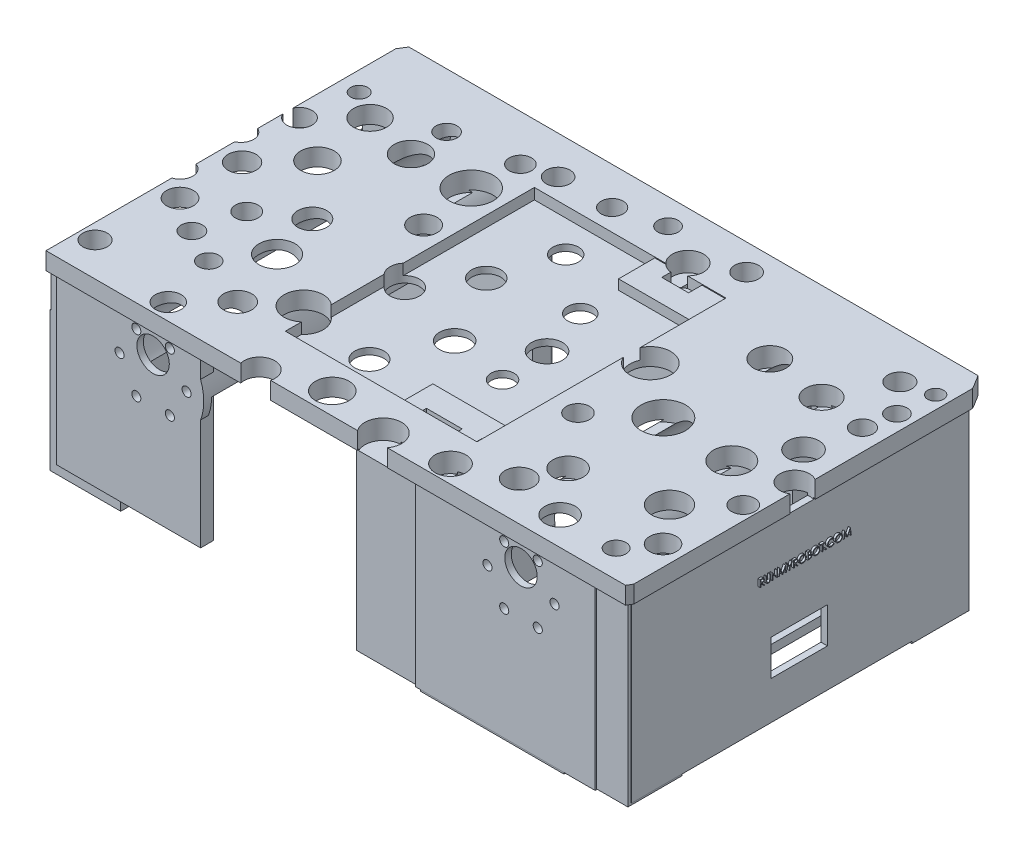
from build123d import *

# Parameters (mm, degrees)
MOTORHOLDERS_DEPTH            = 80
MOTORHOLDERS_DEPTH_BACK       = 80
MOTORHOLDERSSKETCH_R          = 23.41
MOTORHOLDERS_2_DEPTH          = 80
MOTORHOLDERS_2_DEPTH_BACK     = 80
SKETCH4_W                     = 262.774983374
SKETCH4_H                     = 153.112553215
CUT_EXTRUDE1_DEPTH            = 26
POWERBANKHOLDERS_DEPTH        = 30
POWERBANKHOLDERS_DEPTH_BACK   = 59
SKETCH6_W                     = 74.414236541
SKETCH6_H                     = 13.420779118
SKETCH6_W_2                   = 20.810206851
SKETCH6_H_2                   = 2.021058642
POWERBANKHOLDERS_2_DEPTH      = 30
POWERBANKHOLDERS_2_DEPTH_BACK = 59
SKETCH6_W_3                   = 32.64776113
SKETCH6_H_3                   = 26.17260787
SKETCH6_W_4                   = 10.842850571
SKETCH6_H_4                   = 10.347679347
POWERBANKHOLDERS_3_DEPTH      = 30
POWERBANKHOLDERS_3_DEPTH_BACK = 59
SKETCH6_W_5                   = 55.674763771
SKETCH6_H_5                   = 37.111507406
SKETCH6_W_6                   = 12.844328805
SKETCH6_H_6                   = 18.336479725
SKETCH6_W_7                   = 12.407504742
SKETCH6_H_7                   = 16.443461188
POWERBANKHOLDERS_4_DEPTH      = 30
POWERBANKHOLDERS_4_DEPTH_BACK = 59
SKETCH6_W_8                   = 56.474336521
SKETCH6_H_8                   = 35.272094794
SKETCH6_W_9                   = 11.134493861
SKETCH6_H_9                   = 18.035399163
SKETCH6_W_10                  = 16.537391536
SKETCH6_H_10                  = 14.436538778
POWERBANKHOLDERS_5_DEPTH      = 30
POWERBANKHOLDERS_5_DEPTH_BACK = 59
SKETCH6_W_11                  = 28.150495439
SKETCH6_H_11                  = 24.933985152
SKETCH6_W_12                  = 10.177859407
SKETCH6_H_12                  = 9.83070569
POWERBANKHOLDERS_6_DEPTH      = 30
POWERBANKHOLDERS_6_DEPTH_BACK = 59
SKETCH6_W_13                  = 30.670744753
SKETCH6_H_13                  = 26.330219561
SKETCH6_W_14                  = 9.898416255
SKETCH6_H_14                  = 10.635603546
POWERBANKCUT_DEPTH            = 64
BOTTOMPLATE_DEPTH             = 5
BOTTOMPLATE_DEPTH_BACK        = 3
SKETCH21_R                    = 156.395305675
SKETCH21_W                    = 88.537320887
SKETCH21_H                    = 115.069025425
SKETCH23_W                    = 66.548697278
SKETCH23_H                    = 81.163054316
SKETCH23_W_2                  = 82.936115801
SKETCH23_H_2                  = 87.063331284
MOTORMOUNTINGSUPPORT1_DEPTH   = 6
SKETCH24_W                    = 62.643465408
SKETCH24_H                    = 86.363062387
SKETCH24_W_2                  = 53.914675369
SKETCH24_H_2                  = 86.674739968
MOTORMOUNTINGSUPPOR2_DEPTH    = 6
SKETCH17_R                    = 2.1
SKETCH17_R_2                  = 7.5
MOTORHOLES1_DEPTH             = 31.5
SKETCH19_R                    = 2.1
SKETCH19_R_2                  = 7.5
CUT_EXTRUDE4_DEPTH            = 30
BOLTHOLESSKETCH3_R            = 2.1
BOLTHOLESSKETCH3_R_2          = 7.5
MOTORHOLES3_DEPTH             = 31.5
BOLTHOLESSKETCH4_R            = 2.1
BOLTHOLESSKETCH4_R_2          = 7.5
MOTORHOLES4_DEPTH             = 15
SKETCH29_W                    = 154.635205036
SKETCH29_H                    = 84.131588093
SKETCH29_W_2                  = 26
SKETCH29_H_2                  = 16.5
BOSS_EXTRUDE8_DEPTH           = 3
SKETCH27_W                    = 226.46009322
SKETCH27_H                    = 129.985211715
BOSS_EXTRUDE6_DEPTH           = 3
BOSS_EXTRUDE7_DEPTH           = 1.5
BOSS_EXTRUDE7_DEPTH_BACK      = 2.5
SKETCH28_W                    = 66.387115975
SKETCH28_H                    = 157.698901517
MOTORHOLDERCUT_DEPTH          = 77
MOTORHOLDERCUT_DEPTH_BACK     = 77
MOTORHOLDEREXTRUDESKETCH_R    = 20.415
BOSS_EXTRUDE9_DEPTH           = 1
CUT_EXTRUDE5_DEPTH            = 20
CUT_EXTRUDE5_DEPTH_BACK       = 20
SKETCH32_W                    = 420.045569038
SKETCH32_H                    = 425.046527557
SKETCH32_W_2                  = 269.205670794
SKETCH32_H_2                  = 165.352220901
CUT_EXTRUDE6_DEPTH            = 6
CUT_EXTRUDE6_DEPTH_BACK       = 4
SKETCH33_R                    = 4.878708615
SKETCH33_R_2                  = 6.181351086
SKETCH33_R_3                  = 6.433882783
SKETCH33_R_4                  = 5.21789983
SKETCH33_R_5                  = 4.660049758
SKETCH33_R_6                  = 5.966691486
SKETCH33_R_7                  = 6.493732804
SKETCH33_R_8                  = 8.369821784
SKETCH33_R_9                  = 6.704965475
SKETCH33_R_10                 = 7.114120563
SKETCH33_R_11                 = 9.043160687
SKETCH33_R_12                 = 6.215818982
SKETCH33_R_13                 = 6.789179994
SKETCH33_R_14                 = 6.968868777
SKETCH33_R_15                 = 6.740603587
SKETCH33_R_16                 = 5.324146543
SKETCH33_R_17                 = 5.813460442
SKETCH33_R_18                 = 5.952709447
SKETCH33_R_19                 = 7.751280589
SKETCH33_R_20                 = 7.776490231
SKETCH33_R_21                 = 7.593615195
SKETCH33_R_22                 = 10.212279958
SKETCH33_R_23                 = 7.136735682
SKETCH33_R_24                 = 9.41370682
SKETCH33_R_25                 = 10.286425069
SKETCH33_R_26                 = 7.494510492
SKETCH33_R_27                 = 7.361418564
SKETCH33_R_28                 = 8.239982484
SKETCH33_R_29                 = 8.500486154
SKETCH33_R_30                 = 7.133003204
SKETCH33_R_31                 = 5.343899141
SKETCH33_R_32                 = 4.943989491
SKETCH33_R_33                 = 5.578752576
SKETCH33_R_34                 = 4.569697681
SKETCH33_R_35                 = 5.851376962
SKETCH33_R_36                 = 3.919335702
SKETCH33_R_37                 = 4.854453102
SKETCH33_R_38                 = 5.167520393
SKETCH33_R_39                 = 5.500990773
SKETCH33_R_40                 = 5.113041603
SKETCH33_R_41                 = 4.707503319
SKETCH33_R_42                 = 7.219095323
SKETCH33_R_43                 = 5.516309897
SKETCH33_R_44                 = 8.49307801
SKETCH33_R_45                 = 7.145818309
SKETCH33_R_46                 = 6.536545096
SKETCH33_R_47                 = 6.977982036
SKETCH33_R_48                 = 6.14592579
SKETCH33_R_49                 = 4.70029788
SKETCH33_R_50                 = 3.655831127
SKETCH33_R_51                 = 6.791051852
SKETCH33_R_52                 = 5.847652074


with BuildPart() as part:
    # MotorHoldersSketch → MotorHolders (new, two sides: drawn at the far end of the back side and taken through both)
    with BuildSketch(Plane.XY.offset(-MOTORHOLDERS_DEPTH_BACK)):
        Circle(MOTORHOLDERSSKETCH_R)
    extrude(amount=MOTORHOLDERS_DEPTH + MOTORHOLDERS_DEPTH_BACK)


with BuildPart() as body_2:
    # MotorHoldersSketch → MotorHolders 2 (new, two sides: drawn at the far end of the back side and taken through both)
    with BuildSketch(Plane.XY.offset(-MOTORHOLDERS_2_DEPTH_BACK)):
        with Locations((170, 0)):
            Circle(MOTORHOLDERSSKETCH_R)
    extrude(amount=MOTORHOLDERS_2_DEPTH + MOTORHOLDERS_2_DEPTH_BACK)


with BuildPart() as cut_extrude1_tool:
    # Sketch4 → Cut-Extrude1 (new body)
    with BuildSketch(Plane(origin=(0, 0, 0), x_dir=(1, 0, 0), z_dir=(0, 1, 0))):
        with Locations((89.893628689, 0.176832173)):
            Rectangle(SKETCH4_W, SKETCH4_H)
    extrude(amount=-CUT_EXTRUDE1_DEPTH)


with BuildPart() as part_1:
    add(part.part)

    # Cut-Extrude1: cut by cut_extrude1_tool
    add(cut_extrude1_tool.part, mode=Mode.SUBTRACT)


with BuildPart() as body_2_1:
    add(body_2.part)

    # Cut-Extrude1: cut by cut_extrude1_tool
    add(cut_extrude1_tool.part, mode=Mode.SUBTRACT)


with BuildPart() as body_3:
    # Sketch6 → PowerBankHolders (new, two sides: drawn at the far end of the back side and taken through both)
    with BuildSketch(Plane(origin=(170, -34.829272125, 0), x_dir=(-1, 0, 0), z_dir=(0, -1, 0)).offset(-POWERBANKHOLDERS_DEPTH_BACK)):
        with Locations((182.378728269, 72.238602394)):
            Rectangle(SKETCH6_W, SKETCH6_H)
        with Locations((203.359863582, 72.025840015)):
            Rectangle(SKETCH6_W_2, SKETCH6_H_2, mode=Mode.SUBTRACT)
    extrude(amount=POWERBANKHOLDERS_DEPTH + POWERBANKHOLDERS_DEPTH_BACK)


with BuildPart() as body_4:
    # Sketch6 → PowerBankHolders 2 (new, two sides: drawn at the far end of the back side and taken through both)
    with BuildSketch(Plane(origin=(170, -34.829272125, 0), x_dir=(-1, 0, 0), z_dir=(0, -1, 0)).offset(-POWERBANKHOLDERS_2_DEPTH_BACK)):
        with Locations((202.990846936, -65.195848087)):
            Rectangle(SKETCH6_W_3, SKETCH6_H_3)
        with Locations((206.519672379, -65.314281269)):
            Rectangle(SKETCH6_W_4, SKETCH6_H_4, mode=Mode.SUBTRACT)
    extrude(amount=POWERBANKHOLDERS_2_DEPTH + POWERBANKHOLDERS_2_DEPTH_BACK)


with BuildPart() as body_5:
    # Sketch6 → PowerBankHolders 3 (new, two sides: drawn at the far end of the back side and taken through both)
    with BuildSketch(Plane(origin=(170, -34.829272125, 0), x_dir=(-1, 0, 0), z_dir=(0, -1, 0)).offset(-POWERBANKHOLDERS_3_DEPTH_BACK)):
        with Locations((47.827743092, 59.306920349)):
            Rectangle(SKETCH6_W_5, SKETCH6_H_5)
        with Locations((34.93306737, 60.00949088)):
            Rectangle(SKETCH6_W_6, SKETCH6_H_6, mode=Mode.SUBTRACT)
        with Locations((60.073413265, 59.541495334)):
            Rectangle(SKETCH6_W_7, SKETCH6_H_7, mode=Mode.SUBTRACT)
    extrude(amount=POWERBANKHOLDERS_3_DEPTH + POWERBANKHOLDERS_3_DEPTH_BACK)


with BuildPart() as body_6:
    # Sketch6 → PowerBankHolders 4 (new, two sides: drawn at the far end of the back side and taken through both)
    with BuildSketch(Plane(origin=(170, -34.829272125, 0), x_dir=(-1, 0, 0), z_dir=(0, -1, 0)).offset(-POWERBANKHOLDERS_4_DEPTH_BACK)):
        with Locations((48.322417758, -61.807610384)):
            Rectangle(SKETCH6_W_8, SKETCH6_H_8)
        with Locations((37.73953158, -63.792391966)):
            Rectangle(SKETCH6_W_9, SKETCH6_H_9, mode=Mode.SUBTRACT)
        with Locations((59.979410768, -62.645522509)):
            Rectangle(SKETCH6_W_10, SKETCH6_H_10, mode=Mode.SUBTRACT)
    extrude(amount=POWERBANKHOLDERS_4_DEPTH + POWERBANKHOLDERS_4_DEPTH_BACK)


with BuildPart() as body_7:
    # Sketch6 → PowerBankHolders 5 (new, two sides: drawn at the far end of the back side and taken through both)
    with BuildSketch(Plane(origin=(170, -34.829272125, 0), x_dir=(-1, 0, 0), z_dir=(0, -1, 0)).offset(-POWERBANKHOLDERS_5_DEPTH_BACK)):
        with Locations((-34.775388772, -66.976665205)):
            Rectangle(SKETCH6_W_11, SKETCH6_H_11)
        with Locations((-36.725173705, -67.894738702)):
            Rectangle(SKETCH6_W_12, SKETCH6_H_12, mode=Mode.SUBTRACT)
    extrude(amount=POWERBANKHOLDERS_5_DEPTH + POWERBANKHOLDERS_5_DEPTH_BACK)


with BuildPart() as body_8:
    # Sketch6 → PowerBankHolders 6 (new, two sides: drawn at the far end of the back side and taken through both)
    with BuildSketch(Plane(origin=(170, -34.829272125, 0), x_dir=(-1, 0, 0), z_dir=(0, -1, 0)).offset(-POWERBANKHOLDERS_6_DEPTH_BACK)):
        with Locations((-33.722690809, 64.697564271)):
            Rectangle(SKETCH6_W_13, SKETCH6_H_13)
        with Locations((-36.585452129, 63.859928969)):
            Rectangle(SKETCH6_W_14, SKETCH6_H_14, mode=Mode.SUBTRACT)
    extrude(amount=POWERBANKHOLDERS_6_DEPTH + POWERBANKHOLDERS_6_DEPTH_BACK)


with BuildPart() as powerbankcut_tool:
    # Sketch11 → PowerBankCut (new body)
    with BuildSketch(Plane(origin=(0, -20.425, 0), x_dir=(1, 0, 0), z_dir=(0, 1, 0))):
        Polygon((-18.932660375, -64.758061011), (-18.932660375, 72.241938989), (188.932660375, 63.758061011), (188.932660375, -71.241938989), align=None)
    extrude(amount=-POWERBANKCUT_DEPTH)


with BuildPart() as body_3_1:
    add(body_3.part)

    # PowerBankCut: cut by powerbankcut_tool
    add(powerbankcut_tool.part, mode=Mode.SUBTRACT)



with BuildPart() as body_4_1:
    add(body_4.part)

    # PowerBankCut: cut by powerbankcut_tool
    add(powerbankcut_tool.part, mode=Mode.SUBTRACT)


with BuildPart() as body_5_1:
    add(body_5.part)

    # PowerBankCut: cut by powerbankcut_tool
    add(powerbankcut_tool.part, mode=Mode.SUBTRACT)


with BuildPart() as body_6_1:
    add(body_6.part)

    # PowerBankCut: cut by powerbankcut_tool
    add(powerbankcut_tool.part, mode=Mode.SUBTRACT)


with BuildPart() as body_8_1:
    add(body_8.part)

    # PowerBankCut: cut by powerbankcut_tool
    add(powerbankcut_tool.part, mode=Mode.SUBTRACT)


with BuildPart() as body_3_2:
    add(body_3_1.part)

    add(body_4_1.part)  # BottomPlate merges body 4

    add(body_2_1.part)  # BottomPlate merges body 2

    add(part_1.part)  # BottomPlate merges part

    add(body_5_1.part)  # BottomPlate merges body 5

    add(body_6_1.part)  # BottomPlate merges body 6
    # Sketch21 → BottomPlate (add, two sides: drawn at the far end of the back side and taken through both)
    with BuildSketch(Plane(origin=(0, 19.575, 0), x_dir=(1, 0, 0), z_dir=(0, 1, 0)).offset(-BOTTOMPLATE_DEPTH_BACK)):
        with Locations((85, 0)):
            Circle(SKETCH21_R)
        with Locations((82.978570093, -0.057259585)):
            Rectangle(SKETCH21_W, SKETCH21_H, mode=Mode.SUBTRACT)
    extrude(amount=BOTTOMPLATE_DEPTH + BOTTOMPLATE_DEPTH_BACK)


    add(body_7.part)  # MotorMountingSupport1 merges body 7
    # Sketch23 → MotorMountingSupport1 (add)
    with BuildSketch(Plane.XY.offset(80)):
        with Locations((-11.315777772, -18.741332274)):
            Rectangle(SKETCH23_W, SKETCH23_H)
        with Locations((162.789906406, -21.691470758)):
            Rectangle(SKETCH23_W_2, SKETCH23_H_2)
    extrude(amount=-MOTORMOUNTINGSUPPORT1_DEPTH)


    add(body_8_1.part)  # MotorMountingSuppor2 merges body 8
    # Sketch24 → MotorMountingSuppor2 (add)
    with BuildSketch(Plane(origin=(0, 0, -80), x_dir=(-1, 0, 0), z_dir=(0, 0, -1))):
        with Locations((-170.868787608, -23.94412431)):
            Rectangle(SKETCH24_W, SKETCH24_H)
        with Locations((2.593149567, -20.814772641)):
            Rectangle(SKETCH24_W_2, SKETCH24_H_2)
    extrude(amount=-MOTORMOUNTINGSUPPOR2_DEPTH)

    # Sketch17 → MotorHoles1 (cut)
    with BuildSketch(Plane.XY.offset(80)):
        with Locations((185.5, 0)):
            Circle(SKETCH17_R)
        with Locations((177.75, -13.42)):
            Circle(SKETCH17_R)
        with Locations((162.25, -13.42)):
            Circle(SKETCH17_R)
        with Locations((154.5, 0)):
            Circle(SKETCH17_R)
        with Locations((162.25, 13.42)):
            Circle(SKETCH17_R)
        with Locations((177.75, 13.42)):
            Circle(SKETCH17_R)
        with Locations((170, 7)):
            Circle(SKETCH17_R_2)
    extrude(amount=-MOTORHOLES1_DEPTH, mode=Mode.SUBTRACT)

    # Sketch19 → Cut-Extrude4 (cut)
    with BuildSketch(Plane(origin=(0, 0, -80), x_dir=(-1, 0, 0), z_dir=(0, 0, -1))):
        with Locations((-185.5, 0)):
            Circle(SKETCH19_R)
        with Locations((-177.75, -13.42)):
            Circle(SKETCH19_R)
        with Locations((-162.25, -13.42)):
            Circle(SKETCH19_R)
        with Locations((-154.5, 0)):
            Circle(SKETCH19_R)
        with Locations((-162.25, 13.42)):
            Circle(SKETCH19_R)
        with Locations((-177.75, 13.42)):
            Circle(SKETCH19_R)
        with Locations((-170, 7)):
            Circle(SKETCH19_R_2)
    extrude(amount=-CUT_EXTRUDE4_DEPTH, mode=Mode.SUBTRACT)

    # BoltHolesSketch3 → MotorHoles3 (cut)
    with BuildSketch(Plane.XY.offset(80)):
        with Locations((7.75, -13.42)):
            Circle(BOLTHOLESSKETCH3_R)
        with Locations((15.5, 0)):
            Circle(BOLTHOLESSKETCH3_R)
        with Locations((7.75, 13.42)):
            Circle(BOLTHOLESSKETCH3_R)
        with Locations((-7.75, 13.42)):
            Circle(BOLTHOLESSKETCH3_R)
        with Locations((-15.5, 0)):
            Circle(BOLTHOLESSKETCH3_R)
        with Locations((-7.75, -13.42)):
            Circle(BOLTHOLESSKETCH3_R)
        with Locations((0, 7)):
            Circle(BOLTHOLESSKETCH3_R_2)
    extrude(amount=-MOTORHOLES3_DEPTH, mode=Mode.SUBTRACT)

    # BoltHolesSketch4 → MotorHoles4 (cut)
    with BuildSketch(Plane(origin=(0, 0, -80), x_dir=(-1, 0, 0), z_dir=(0, 0, -1))):
        with Locations((-15.5, 0)):
            Circle(BOLTHOLESSKETCH4_R)
        with Locations((-7.75, 13.42)):
            Circle(BOLTHOLESSKETCH4_R)
        with Locations((7.75, 13.42)):
            Circle(BOLTHOLESSKETCH4_R)
        with Locations((15.5, 0)):
            Circle(BOLTHOLESSKETCH4_R)
        with Locations((7.75, -13.42)):
            Circle(BOLTHOLESSKETCH4_R)
        with Locations((-7.75, -13.42)):
            Circle(BOLTHOLESSKETCH4_R)
        with Locations((0, 7)):
            Circle(BOLTHOLESSKETCH4_R_2)
    extrude(amount=-MOTORHOLES4_DEPTH, mode=Mode.SUBTRACT)

    # Sketch29 → Boss-Extrude8 (add)
    with BuildSketch(Plane(origin=(219.058063185, 0, 0), x_dir=(0, 0, -1), z_dir=(1, 0, 0))):
        with Locations((-0.622085312, -21.859578752)):
            Rectangle(SKETCH29_W, SKETCH29_H)
        with Locations((-0.45071267, -38.005879342)):
            Rectangle(SKETCH29_W_2, SKETCH29_H_2, mode=Mode.SUBTRACT)
    extrude(amount=-BOSS_EXTRUDE8_DEPTH)

    # Sketch27 → Boss-Extrude6 (add)
    with BuildSketch(Plane(origin=(0, 16.575, 0), x_dir=(-1, 0, 0), z_dir=(0, -1, 0))):
        with Locations((-81.596376522, -0.440920076)):
            Rectangle(SKETCH27_W, SKETCH27_H)
    extrude(amount=-BOSS_EXTRUDE6_DEPTH)

    # Sketch28 → Boss-Extrude7 (add, two sides: drawn at the far end of the back side and taken through both)
    with BuildSketch(Plane(origin=(0, -64.829272125, 0), x_dir=(-1, 0, 0), z_dir=(0, -1, 0)).offset(-BOSS_EXTRUDE7_DEPTH_BACK)):
        with Locations((-156.196154729, -0.699595313)):
            Rectangle(SKETCH28_W, SKETCH28_H)
    extrude(amount=BOSS_EXTRUDE7_DEPTH + BOSS_EXTRUDE7_DEPTH_BACK)

    # MotorHolderExtrudeSketch → MotorHolderCut (cut, two sides: drawn at the far end of the back side and taken through both)
    with BuildSketch(Plane.XY.offset(-MOTORHOLDERCUT_DEPTH_BACK)):
        with Locations((170, 0)):
            Circle(MOTORHOLDEREXTRUDESKETCH_R)
        Circle(MOTORHOLDEREXTRUDESKETCH_R)
    extrude(amount=MOTORHOLDERCUT_DEPTH + MOTORHOLDERCUT_DEPTH_BACK, mode=Mode.SUBTRACT)

    # Sketch31 → Boss-Extrude9 (add)
    # profile 1 of 14: a face of its own
    with BuildSketch(Plane(origin=(219.058063185, 0, 0), x_dir=(0, 0, -1), z_dir=(1, 0, 0))):
        with BuildLine():
            Line((-19.523067462, -3.211949724), (-18.887685851, -3.211949724))
            add(Edge.make_bspline(
                [(-18.887685851, -3.211949724), (-18.84528497, -3.212090863), (-18.763870582, -3.212361865), (-18.647236258, -3.21387295), (-18.541257392, -3.218203972), (-18.445989395, -3.221931045), (-18.361434015, -3.228727306), (-18.287331972, -3.235223036), (-18.224024561, -3.243726285), (-18.185701539, -3.251623347), (-18.168349914, -3.255198923)],
                knots=[0, 0, 0, 0, 1.410062039, 2.707475311, 3.878576406, 4.937260626, 5.877586885, 6.699081471, 7.410979367, 8, 8, 8, 8], degree=3))
            add(Edge.make_bspline(
                [(-18.168349914, -3.255198923), (-18.145121047, -3.260938203), (-18.09915885, -3.272294329), (-18.032982719, -3.296296966), (-17.969923296, -3.32407334), (-17.910242527, -3.356697572), (-17.854239345, -3.394411837), (-17.801336306, -3.436565062), (-17.75129335, -3.482926599), (-17.7061343, -3.534665348), (-17.663553874, -3.58894561), (-17.627641334, -3.647641161), (-17.596683742, -3.709019832), (-17.572036202, -3.773705847), (-17.552189754, -3.841071883), (-17.538195951, -3.911728148), (-17.529803803, -3.985352747), (-17.528949405, -4.035570279), (-17.52851618, -4.061033258)],
                knots=[0, 0, 0, 0, 1.027469482, 2.033020251, 3.019912614, 3.986113645, 4.951240523, 5.91722682, 6.890402269, 7.87763091, 8.8651537, 9.85103654, 10.82876324, 11.815024772, 12.821070561, 13.842952187, 14.906261191, 16, 16, 16, 16], degree=3))
            add(Edge.make_bspline(
                [(-17.52851618, -4.061033258), (-17.529848771, -4.10333796), (-17.532449001, -4.185885391), (-17.556692488, -4.305683476), (-17.596404045, -4.417433783), (-17.651125886, -4.520995604), (-17.720812125, -4.614350261), (-17.8045639, -4.696347317), (-17.902427933, -4.764963524), (-17.993531669, -4.812545711), (-18.074008122, -4.843019278), (-18.14025977, -4.864460832), (-18.2125291, -4.881027043), (-18.290123682, -4.89586802), (-18.373366426, -4.907072771), (-18.462057819, -4.915279325), (-18.556261114, -4.920408355), (-18.620975841, -4.921172174), (-18.654267382, -4.921565109)],
                knots=[0, 0, 0, 0, 1.260483769, 2.459530307, 3.627416485, 4.787058657, 5.939039949, 7.08810263, 8.267026773, 9.491475466, 10.141966685, 10.831826277, 11.566392101, 12.351337768, 13.187381173, 14.07005841, 15.007169909, 16, 16, 16, 16], degree=3))
            Line((-18.654267382, -4.921565109), (-17.487811051, -6.386949724))
            Line((-17.487811051, -6.386949724), (-17.840164818, -6.386949724))
            Line((-17.840164818, -6.386949724), (-19.006621148, -4.921565109))
            Line((-19.006621148, -4.921565109), (-19.238131564, -4.921565109))
            Line((-19.238131564, -4.921565109), (-19.238131564, -6.386949724))
            Line((-19.238131564, -6.386949724), (-19.523067462, -6.386949724))
            Line((-19.523067462, -6.386949724), (-19.523067462, -3.211949724))
        make_face()
        with BuildLine():
            Line((-19.238131564, -3.53759075), (-19.238131564, -4.595924083))
            Line((-19.238131564, -4.595924083), (-18.656811452, -4.600376207))
            add(Edge.make_bspline(
                [(-18.656811452, -4.600376207), (-18.629669703, -4.600388214), (-18.577061261, -4.600411488), (-18.500951373, -4.596788563), (-18.430085271, -4.592667124), (-18.364734018, -4.586363075), (-18.304868417, -4.578238638), (-18.250518392, -4.568075931), (-18.201595224, -4.556235846), (-18.144537264, -4.537910085), (-18.080822696, -4.508876054), (-18.011579158, -4.466634495), (-17.952612751, -4.413503937), (-17.902794405, -4.352749444), (-17.862762706, -4.285950847), (-17.834539628, -4.213908855), (-17.816630413, -4.138442191), (-17.814518089, -4.086573479), (-17.813452077, -4.06039724)],
                knots=[0, 0, 0, 0, 1.146690395, 2.22261258, 3.21895312, 4.145990853, 4.996080663, 5.770904154, 6.481378293, 7.121626537, 8.300444488, 9.431385265, 10.535395872, 11.636531494, 12.74115979, 13.810798291, 14.895190096, 16, 16, 16, 16], degree=3))
            add(Edge.make_bspline(
                [(-17.813452077, -4.06039724), (-17.814542573, -4.034864277), (-17.816703537, -3.98426726), (-17.834346348, -3.910193685), (-17.864181716, -3.840282951), (-17.904388317, -3.774819454), (-17.953373265, -3.715396394), (-18.010811567, -3.664553619), (-18.075132708, -3.622598748), (-18.135250152, -3.595788703), (-18.188984045, -3.579351407), (-18.235638094, -3.56778428), (-18.288353506, -3.558491083), (-18.347386243, -3.551045199), (-18.412484294, -3.544645357), (-18.483976813, -3.540334815), (-18.561389464, -3.537782238), (-18.61504418, -3.537656065), (-18.642819064, -3.53759075)],
                knots=[0, 0, 0, 0, 1.101028733, 2.181837193, 3.264309656, 4.369019818, 5.486613113, 6.575447106, 7.666700264, 8.788928104, 9.402425223, 10.0903467, 10.862060571, 11.710948788, 12.657782767, 13.684531032, 14.801375019, 16, 16, 16, 16], degree=3))
            Line((-18.642819064, -3.53759075), (-19.238131564, -3.53759075))
        make_face(mode=Mode.SUBTRACT)
    # profile 2 of 14: a face of its own
    with BuildSketch(Plane(origin=(219.058063185, 0, 0), x_dir=(0, 0, -1), z_dir=(1, 0, 0))):
        with BuildLine():
            Line((-16.836529, -3.211949724), (-16.551593103, -3.211949724))
            Line((-16.551593103, -3.211949724), (-16.551593103, -5.11427845))
            add(Edge.make_bspline(
                [(-16.551593103, -5.11427845), (-16.551635506, -5.141203118), (-16.551715974, -5.192297314), (-16.551178479, -5.265021415), (-16.549673195, -5.329675717), (-16.548724179, -5.38650944), (-16.546612955, -5.435261789), (-16.544891155, -5.476196892), (-16.542677222, -5.509120919), (-16.540016465, -5.528335045), (-16.53887275, -5.536594155)],
                knots=[0, 0, 0, 0, 1.528628734, 2.90083645, 4.128790002, 5.200304208, 6.127813768, 6.898992206, 7.526736466, 8, 8, 8, 8], degree=3))
            add(Edge.make_bspline(
                [(-16.53887275, -5.536594155), (-16.534176055, -5.566390862), (-16.525047308, -5.624305338), (-16.501782379, -5.706772136), (-16.469290789, -5.781095673), (-16.430788886, -5.849595202), (-16.380050017, -5.910364121), (-16.319268239, -5.966345406), (-16.245628406, -6.015305543), (-16.163749142, -6.06007378), (-16.075497534, -6.096055676), (-15.985317314, -6.123263942), (-15.89456404, -6.139845516), (-15.83380709, -6.141765519), (-15.803636372, -6.142718955)],
                knots=[0, 0, 0, 0, 1.035780045, 2.013197591, 2.933192213, 3.817615948, 4.702609284, 5.640816605, 6.646850145, 7.73207398, 8.84249596, 9.914020372, 10.964143139, 12, 12, 12, 12], degree=3))
            add(Edge.make_bspline(
                [(-15.803636372, -6.142718955), (-15.77773405, -6.141744819), (-15.726079012, -6.139802174), (-15.649328893, -6.127772162), (-15.574580223, -6.106090935), (-15.501463892, -6.078114868), (-15.432928356, -6.041150982), (-15.368935376, -5.998451006), (-15.311818093, -5.948366854), (-15.259695481, -5.892940113), (-15.214306646, -5.830401866), (-15.174962825, -5.762113841), (-15.142735732, -5.687048362), (-15.126821248, -5.634293993), (-15.118645386, -5.607192112)],
                knots=[0, 0, 0, 0, 0.994687771, 1.983630487, 2.973142513, 3.978332533, 4.983357753, 5.956394766, 6.925816176, 7.893390482, 8.871859704, 9.88551698, 10.913711441, 12, 12, 12, 12], degree=3))
            add(Edge.make_bspline(
                [(-15.118645386, -5.607192112), (-15.115923844, -5.595990191), (-15.109859151, -5.571027797), (-15.104192189, -5.52882634), (-15.098289841, -5.479033846), (-15.094194481, -5.421292558), (-15.090201945, -5.355795962), (-15.087813372, -5.282202857), (-15.08670935, -5.200780471), (-15.086380347, -5.143959617), (-15.086208487, -5.11427845)],
                knots=[0, 0, 0, 0, 0.558680831, 1.244966039, 2.062412453, 2.990489873, 4.051219941, 5.244515665, 6.560634259, 8, 8, 8, 8], degree=3))
            Line((-15.086208487, -5.11427845), (-15.086208487, -3.211949724))
            Line((-15.086208487, -3.211949724), (-14.80127259, -3.211949724))
            Line((-14.80127259, -3.211949724), (-14.80127259, -5.129542873))
            add(Edge.make_bspline(
                [(-14.80127259, -5.129542873), (-14.801503113, -5.164103546), (-14.801952994, -5.231550799), (-14.805854231, -5.330385246), (-14.81207451, -5.424141165), (-14.82086299, -5.512831158), (-14.832507985, -5.59613786), (-14.84545765, -5.674791471), (-14.861949083, -5.7482274), (-14.881210811, -5.817018236), (-14.903230387, -5.882500809), (-14.931752, -5.944647909), (-14.963887082, -6.005348829), (-15.002000375, -6.06368547), (-15.044827843, -6.119916129), (-15.093316154, -6.17369979), (-15.145861642, -6.225895925), (-15.203337814, -6.275165635), (-15.264797219, -6.320349221), (-15.330057038, -6.360080056), (-15.398615965, -6.393665766), (-15.470295786, -6.421311783), (-15.545127092, -6.442098598), (-15.623111768, -6.457588204), (-15.704427322, -6.466389574), (-15.759730975, -6.46769761), (-15.787735931, -6.468359981)],
                knots=[0, 0, 0, 0, 1.316592851, 2.569410997, 3.76748051, 4.895814652, 5.963796859, 6.97159953, 7.931736103, 8.829262218, 9.692595152, 10.560224239, 11.431080259, 12.30701507, 13.211635791, 14.121146779, 15.063487852, 16.031507147, 17.00238618, 17.966455255, 18.938106653, 19.907068911, 20.888905087, 21.893141452, 22.933117798, 24, 24, 24, 24], degree=3))
            add(Edge.make_bspline(
                [(-15.787735931, -6.468359981), (-15.818278617, -6.467648086), (-15.878203258, -6.466251353), (-15.96650279, -6.458247858), (-16.051152097, -6.4431726), (-16.133045214, -6.423977508), (-16.211067208, -6.397503689), (-16.286263404, -6.366571819), (-16.357345922, -6.328583161), (-16.425467931, -6.286316298), (-16.48880896, -6.238759662), (-16.546954461, -6.186925361), (-16.60000043, -6.131643733), (-16.647052747, -6.072316258), (-16.688890978, -6.009404353), (-16.724931957, -5.942730042), (-16.755877543, -5.872319141), (-16.771849215, -5.823375881), (-16.779923431, -5.798633418)],
                knots=[0, 0, 0, 0, 1.13879206, 2.234305948, 3.301075583, 4.341971843, 5.366689343, 6.369221514, 7.369726634, 8.367512178, 9.355451585, 10.318319045, 11.268648973, 12.207971039, 13.137398894, 14.081662264, 15.030215811, 16, 16, 16, 16], degree=3))
            add(Edge.make_bspline(
                [(-16.779923431, -5.798633418), (-16.784619853, -5.781731011), (-16.794806497, -5.745069314), (-16.80571516, -5.684393714), (-16.814885541, -5.614530182), (-16.823508441, -5.535473935), (-16.828596567, -5.447163699), (-16.833057386, -5.349637754), (-16.836560426, -5.242778174), (-16.836539768, -5.168343007), (-16.836529, -5.129542873)],
                knots=[0, 0, 0, 0, 0.625038921, 1.35572334, 2.194682327, 3.136881307, 4.189498639, 5.346923369, 6.617055217, 8, 8, 8, 8], degree=3))
            Line((-16.836529, -5.129542873), (-16.836529, -3.211949724))
        make_face()
    # profile 3 of 14: a face of its own
    with BuildSketch(Plane(origin=(219.058063185, 0, 0), x_dir=(0, 0, -1), z_dir=(1, 0, 0))):
        Polygon((-13.987170026, -6.386949724), (-13.987170026, -3.211949724), (-13.927384369, -3.211949724), (-11.829798231, -5.710862985), (-11.829798231, -3.211949724), (-11.544862334, -3.211949724), (-11.544862334, -6.386949724), (-11.609736132, -6.386949724), (-13.702234128, -3.893760622), (-13.702234128, -6.386949724), align=None)
    # profile 4 of 14: a face of its own
    with BuildSketch(Plane(origin=(219.058063185, 0, 0), x_dir=(0, 0, -1), z_dir=(1, 0, 0))):
        Polygon((-10.893580282, -6.386949724), (-10.474444665, -3.211949724), (-10.433739537, -3.211949724), (-9.122907205, -5.817077929), (-7.815254962, -3.211949724), (-7.773913816, -3.211949724), (-7.352234128, -6.386949724), (-7.638442061, -6.386949724), (-7.942458487, -4.102374404), (-9.088562253, -6.386949724), (-9.152800034, -6.386949724), (-10.303355923, -4.097286263), (-10.606736332, -6.386949724), align=None)
    # profile 5 of 14: a face of its own
    with BuildSketch(Plane(origin=(219.058063185, 0, 0), x_dir=(0, 0, -1), z_dir=(1, 0, 0))):
        Polygon((-6.945182846, -3.211949724), (-6.618905803, -3.211949724), (-5.784450675, -4.576207537), (-4.951267582, -3.211949724), (-4.624990539, -3.211949724), (-5.642618744, -4.877679892), (-5.642618744, -6.386949724), (-5.927554641, -6.386949724), (-5.927554641, -4.877679892), align=None)
    # profile 6 of 14: a face of its own
    with BuildSketch(Plane(origin=(219.058063185, 0, 0), x_dir=(0, 0, -1), z_dir=(1, 0, 0))):
        with BuildLine():
            Line((-4.055118744, -3.211949724), (-3.419737133, -3.211949724))
            add(Edge.make_bspline(
                [(-3.419737133, -3.211949724), (-3.377336252, -3.212090863), (-3.295921864, -3.212361865), (-3.17928754, -3.21387295), (-3.073308674, -3.218203972), (-2.978040677, -3.221931045), (-2.893485297, -3.228727306), (-2.819383255, -3.235223036), (-2.756075843, -3.243726285), (-2.717752821, -3.251623347), (-2.700401196, -3.255198923)],
                knots=[0, 0, 0, 0, 1.410062039, 2.707475311, 3.878576406, 4.937260626, 5.877586885, 6.699081471, 7.410979367, 8, 8, 8, 8], degree=3))
            add(Edge.make_bspline(
                [(-2.700401196, -3.255198923), (-2.67717233, -3.260938203), (-2.631210132, -3.272294329), (-2.565034001, -3.296296966), (-2.501974578, -3.32407334), (-2.442293809, -3.356697572), (-2.386290627, -3.394411837), (-2.333387588, -3.436565062), (-2.283344632, -3.482926599), (-2.238185582, -3.534665348), (-2.195605156, -3.58894561), (-2.159692616, -3.647641161), (-2.128735024, -3.709019832), (-2.104087484, -3.773705847), (-2.084241036, -3.841071883), (-2.070247233, -3.911728148), (-2.061855085, -3.985352747), (-2.061000687, -4.035570279), (-2.060567462, -4.061033258)],
                knots=[0, 0, 0, 0, 1.027469482, 2.033020251, 3.019912614, 3.986113645, 4.951240523, 5.91722682, 6.890402269, 7.87763091, 8.8651537, 9.85103654, 10.82876324, 11.815024772, 12.821070561, 13.842952187, 14.906261191, 16, 16, 16, 16], degree=3))
            add(Edge.make_bspline(
                [(-2.060567462, -4.061033258), (-2.061900053, -4.10333796), (-2.064500283, -4.185885391), (-2.08874377, -4.305683476), (-2.128455327, -4.417433783), (-2.183177168, -4.520995604), (-2.252863407, -4.614350261), (-2.336615182, -4.696347317), (-2.434479215, -4.764963524), (-2.525582952, -4.812545711), (-2.606059404, -4.843019278), (-2.672311052, -4.864460832), (-2.744580382, -4.881027043), (-2.822174964, -4.89586802), (-2.905417708, -4.907072771), (-2.994109101, -4.915279325), (-3.088312396, -4.920408355), (-3.153027123, -4.921172174), (-3.186318664, -4.921565109)],
                knots=[0, 0, 0, 0, 1.260483769, 2.459530307, 3.627416485, 4.787058657, 5.939039949, 7.08810263, 8.267026773, 9.491475466, 10.141966685, 10.831826277, 11.566392101, 12.351337768, 13.187381173, 14.07005841, 15.007169909, 16, 16, 16, 16], degree=3))
            Line((-3.186318664, -4.921565109), (-2.019862334, -6.386949724))
            Line((-2.019862334, -6.386949724), (-2.3722161, -6.386949724))
            Line((-2.3722161, -6.386949724), (-3.53867243, -4.921565109))
            Line((-3.53867243, -4.921565109), (-3.770182846, -4.921565109))
            Line((-3.770182846, -4.921565109), (-3.770182846, -6.386949724))
            Line((-3.770182846, -6.386949724), (-4.055118744, -6.386949724))
            Line((-4.055118744, -6.386949724), (-4.055118744, -3.211949724))
        make_face()
        with BuildLine():
            Line((-3.770182846, -3.53759075), (-3.770182846, -4.595924083))
            Line((-3.770182846, -4.595924083), (-3.188862734, -4.600376207))
            add(Edge.make_bspline(
                [(-3.188862734, -4.600376207), (-3.161720985, -4.600388214), (-3.109112543, -4.600411488), (-3.033002655, -4.596788563), (-2.962136553, -4.592667124), (-2.8967853, -4.586363075), (-2.836919699, -4.578238638), (-2.782569674, -4.568075931), (-2.733646506, -4.556235846), (-2.676588546, -4.537910085), (-2.612873978, -4.508876054), (-2.54363044, -4.466634495), (-2.484664033, -4.413503937), (-2.434845687, -4.352749444), (-2.394813988, -4.285950847), (-2.36659091, -4.213908855), (-2.348681695, -4.138442191), (-2.346569371, -4.086573479), (-2.345503359, -4.06039724)],
                knots=[0, 0, 0, 0, 1.146690395, 2.22261258, 3.21895312, 4.145990853, 4.996080663, 5.770904154, 6.481378293, 7.121626537, 8.300444488, 9.431385265, 10.535395872, 11.636531494, 12.74115979, 13.810798291, 14.895190096, 16, 16, 16, 16], degree=3))
            add(Edge.make_bspline(
                [(-2.345503359, -4.06039724), (-2.346593855, -4.034864277), (-2.348754819, -3.98426726), (-2.36639763, -3.910193685), (-2.396232998, -3.840282951), (-2.436439599, -3.774819454), (-2.485424547, -3.715396394), (-2.542862849, -3.664553619), (-2.60718399, -3.622598748), (-2.667301434, -3.595788703), (-2.721035327, -3.579351407), (-2.767689376, -3.56778428), (-2.820404788, -3.558491083), (-2.879437525, -3.551045199), (-2.944535576, -3.544645357), (-3.016028095, -3.540334815), (-3.093440746, -3.537782238), (-3.147095462, -3.537656065), (-3.174870346, -3.53759075)],
                knots=[0, 0, 0, 0, 1.101028733, 2.181837193, 3.264309656, 4.369019818, 5.486613113, 6.575447106, 7.666700264, 8.788928104, 9.402425223, 10.0903467, 10.862060571, 11.710948788, 12.657782767, 13.684531032, 14.801375019, 16, 16, 16, 16], degree=3))
            Line((-3.174870346, -3.53759075), (-3.770182846, -3.53759075))
        make_face(mode=Mode.SUBTRACT)
    # profile 7 of 14: a face of its own
    with BuildSketch(Plane(origin=(219.058063185, 0, 0), x_dir=(0, 0, -1), z_dir=(1, 0, 0))):
        with BuildLine():
            add(Edge.make_bspline(
                [(0.117156897, -3.130539468), (0.175947108, -3.132028524), (0.291415931, -3.134953153), (0.461119588, -3.157340626), (0.623130853, -3.196071444), (0.778769479, -3.247654292), (0.926173822, -3.316465056), (1.066453389, -3.399636584), (1.19927441, -3.498040228), (1.322846664, -3.610915313), (1.435928326, -3.733727446), (1.535556094, -3.86478955), (1.619051603, -4.003309178), (1.68761871, -4.148870074), (1.74141102, -4.301143045), (1.778530439, -4.460939891), (1.802241475, -4.627225245), (1.805013501, -4.740642472), (1.806419718, -4.798177689)],
                knots=[0, 0, 0, 0, 1.065120563, 2.091984664, 3.0946048, 4.079830382, 5.057816894, 6.036188127, 7.030412546, 8.04752943, 9.064399622, 10.05169764, 11.02544977, 11.989514704, 12.962713494, 13.945757189, 14.957906945, 16, 16, 16, 16], degree=3))
            add(Edge.make_bspline(
                [(1.806419718, -4.798177689), (1.805013708, -4.855289087), (1.802242299, -4.967862268), (1.778503479, -5.133092392), (1.741273429, -5.291924667), (1.688118245, -5.444093938), (1.619877989, -5.589760728), (1.535826512, -5.72854175), (1.436819843, -5.860482502), (1.324146485, -5.984137563), (1.201318397, -6.097528126), (1.069573798, -6.196333106), (0.931875572, -6.281354276), (0.786451765, -6.349193752), (0.635231017, -6.403415422), (0.47685991, -6.44038388), (0.312080536, -6.464229983), (0.19971184, -6.466968208), (0.142597602, -6.468359981)],
                knots=[0, 0, 0, 0, 1.043624062, 2.057103931, 3.04512605, 4.022047818, 4.998200453, 5.980619268, 6.982898556, 8.009068085, 9.034988726, 10.034168286, 11.015286542, 11.987931943, 12.962482838, 13.94673481, 14.956375938, 16, 16, 16, 16], degree=3))
            add(Edge.make_bspline(
                [(0.142597602, -6.468359981), (0.085062684, -6.466954465), (-0.028353954, -6.464183821), (-0.194848265, -6.440433546), (-0.354757361, -6.403293935), (-0.507623951, -6.350217518), (-0.65353328, -6.281621887), (-0.792770712, -6.197979343), (-0.924777367, -6.098731437), (-1.048458809, -5.986094615), (-1.161624153, -5.863474708), (-1.260284444, -5.732089348), (-1.343945796, -5.594516183), (-1.412311105, -5.450373429), (-1.466435293, -5.300357906), (-1.503360378, -5.14346893), (-1.527250849, -4.98060095), (-1.530003889, -4.869709178), (-1.531400795, -4.813442112)],
                knots=[0, 0, 0, 0, 1.053102029, 2.075944431, 3.073151272, 4.055350789, 5.033113405, 6.020478099, 7.024410459, 8.052272461, 9.079885166, 10.07527673, 11.055994387, 12.023226415, 12.992069828, 13.970394897, 14.97016774, 16, 16, 16, 16], degree=3))
            add(Edge.make_bspline(
                [(-1.531400795, -4.813442112), (-1.530915804, -4.775675334), (-1.529951941, -4.700618222), (-1.518348049, -4.589160663), (-1.501509934, -4.479495566), (-1.477378199, -4.371934778), (-1.445817187, -4.266741599), (-1.408577133, -4.16319055), (-1.363093131, -4.062331029), (-1.311675686, -3.963685238), (-1.254288189, -3.868790923), (-1.190900902, -3.779093015), (-1.123740246, -3.693838826), (-1.050113453, -3.615237615), (-0.972447106, -3.541002798), (-0.889481292, -3.47227519), (-0.801722256, -3.408435056), (-0.708792383, -3.350903747), (-0.612981519, -3.298870818), (-0.514214728, -3.254219567), (-0.41383341, -3.215896354), (-0.311367407, -3.184835034), (-0.207088821, -3.160313116), (-0.10077006, -3.143615016), (0.007504177, -3.131981528), (0.080448731, -3.131022223), (0.117156897, -3.130539468)],
                knots=[0, 0, 0, 0, 1.037015668, 2.060948919, 3.074880161, 4.083647147, 5.086022904, 6.090072063, 7.104153813, 8.122640571, 9.144368836, 10.147691507, 11.138137339, 12.123020368, 13.103399296, 14.087645067, 15.080126199, 16.082011238, 17.087798457, 18.072939717, 19.057185487, 20.037253025, 21.01195951, 21.997135196, 22.992090687, 24, 24, 24, 24], degree=3))
        make_face()
        with BuildLine():
            add(Edge.make_bspline(
                [(0.131149285, -3.456180493), (0.101018867, -3.456547787), (0.041046081, -3.457278862), (-0.048112034, -3.466908833), (-0.136097574, -3.480633803), (-0.22292871, -3.500211326), (-0.308242129, -3.526885002), (-0.392833057, -3.55758354), (-0.475930113, -3.594976958), (-0.557258969, -3.637225054), (-0.636103359, -3.68398729), (-0.710500595, -3.735668821), (-0.780643279, -3.791057652), (-0.846359671, -3.850283048), (-0.907456806, -3.913646615), (-0.965137214, -3.980187754), (-1.017088906, -4.051808398), (-1.064700822, -4.12656641), (-1.107307363, -4.204364415), (-1.145194506, -4.284383362), (-1.176186142, -4.367275978), (-1.201461298, -4.452142964), (-1.222416126, -4.538849909), (-1.235691186, -4.628054572), (-1.245426969, -4.719308709), (-1.246116258, -4.780977963), (-1.246464898, -4.812170077)],
                knots=[0, 0, 0, 0, 1.008559885, 2.007477868, 2.99961109, 3.989939068, 4.984837346, 5.991145699, 7.001802488, 8.033829008, 9.059044045, 10.069351652, 11.065060232, 12.050310815, 13.029377138, 14.011219647, 14.996725999, 15.989392538, 16.977580475, 17.965360261, 18.951710183, 19.937753436, 20.929683414, 21.935841486, 22.955955122, 24, 24, 24, 24], degree=3))
            add(Edge.make_bspline(
                [(-1.246464898, -4.812170077), (-1.245308416, -4.858037234), (-1.243033258, -4.948272122), (-1.223114605, -5.080504653), (-1.192433243, -5.207584741), (-1.147205489, -5.328817045), (-1.090644574, -5.445243644), (-1.020770181, -5.55583171), (-0.937985153, -5.660611132), (-0.843947525, -5.758850412), (-0.741147642, -5.848517677), (-0.631988665, -5.927224484), (-0.517640035, -5.993818067), (-0.397803559, -6.048069812), (-0.273119005, -6.091059074), (-0.142782941, -6.120521832), (-0.007663596, -6.139912424), (0.084439213, -6.141774567), (0.131149285, -6.142718955)],
                knots=[0, 0, 0, 0, 1.032063989, 2.030389145, 3.003944642, 3.970395727, 4.937377036, 5.913328081, 6.909231446, 7.93887556, 8.970685674, 9.976071282, 10.964166581, 11.944589148, 12.933237628, 13.927779006, 14.949070134, 16, 16, 16, 16], degree=3))
            add(Edge.make_bspline(
                [(0.131149285, -6.142718955), (0.162545047, -6.142287605), (0.224812273, -6.141432107), (0.317427497, -6.13281545), (0.408374203, -6.118997969), (0.497524829, -6.099103731), (0.584778193, -6.074205194), (0.670498479, -6.044625326), (0.753772642, -6.007721663), (0.835651209, -5.96694745), (0.914024943, -5.920465307), (0.988842033, -5.870537843), (1.058216672, -5.815230594), (1.123883901, -5.75688515), (1.185231876, -5.694325088), (1.24184574, -5.627631744), (1.29353486, -5.556384147), (1.341128697, -5.481739529), (1.383585942, -5.403728643), (1.420578411, -5.323419578), (1.45196203, -5.241010086), (1.477297174, -5.156381303), (1.497150414, -5.069693962), (1.510830055, -4.980831991), (1.520398996, -4.889973159), (1.521120245, -4.828519804), (1.52148382, -4.797541671)],
                knots=[0, 0, 0, 0, 1.047197238, 2.076906641, 3.100256066, 4.114471768, 5.12198147, 6.126382909, 7.136867548, 8.15857795, 9.17633901, 10.174870724, 11.156907918, 12.133735059, 13.104061851, 14.077631395, 15.04955518, 16.038496417, 17.029181396, 18.010275684, 18.986308667, 19.968651475, 20.955262928, 21.950658345, 22.966943676, 24, 24, 24, 24], degree=3))
            add(Edge.make_bspline(
                [(1.52148382, -4.797541671), (1.521119954, -4.766775464), (1.520398157, -4.705745024), (1.510834626, -4.615519853), (1.497135961, -4.527297297), (1.477394076, -4.441423704), (1.45194858, -4.357877185), (1.42057293, -4.276736207), (1.383574837, -4.197698487), (1.34111309, -4.120959375), (1.293383022, -4.047322291), (1.24122753, -3.976925817), (1.183746107, -3.911091973), (1.12258107, -3.8481955), (1.056204624, -3.789577843), (0.984917443, -3.735219557), (0.909584964, -3.683808801), (0.8298224, -3.637430613), (0.747504671, -3.594600559), (0.663037009, -3.55790572), (0.577376326, -3.526725298), (0.490740452, -3.500130622), (0.402400179, -3.48071048), (0.31295242, -3.466896464), (0.222520928, -3.457282214), (0.161703151, -3.456548899), (0.131149285, -3.456180493)],
                knots=[0, 0, 0, 0, 1.02996197, 2.043119294, 3.035359645, 4.018872909, 4.991431989, 5.957985074, 6.929999688, 7.912076566, 8.892894881, 9.867085534, 10.843653904, 11.817741046, 12.803660682, 13.806313499, 14.818574707, 15.856120519, 16.894564902, 17.924820532, 18.937903209, 19.946497019, 20.957711757, 21.963978472, 22.977135795, 24, 24, 24, 24], degree=3))
        make_face(mode=Mode.SUBTRACT)
    # profile 8 of 14: a face of its own
    with BuildSketch(Plane(origin=(219.058063185, 0, 0), x_dir=(0, 0, -1), z_dir=(1, 0, 0))):
        with BuildLine():
            Line((2.457701769, -3.211949724), (3.077182939, -3.211949724))
            add(Edge.make_bspline(
                [(3.077182939, -3.211949724), (3.107507344, -3.212109155), (3.166283588, -3.212418171), (3.251754082, -3.217210726), (3.33180836, -3.223745484), (3.40646964, -3.234114211), (3.47570342, -3.246625323), (3.539718348, -3.261776256), (3.598310861, -3.279943255), (3.668263129, -3.308832382), (3.748019729, -3.351761256), (3.834378271, -3.415196455), (3.908223545, -3.492786617), (3.971892561, -3.580310169), (4.022512148, -3.676590476), (4.059132868, -3.779332741), (4.082317512, -3.887211749), (4.084701877, -3.961273775), (4.085906897, -3.99870353)],
                knots=[0, 0, 0, 0, 1.001505555, 1.941167018, 2.826882275, 3.653841531, 4.429895133, 5.150066043, 5.825578002, 6.45369114, 7.647487171, 8.808567382, 9.977351308, 11.170798116, 12.373658725, 13.556498008, 14.765093433, 16, 16, 16, 16], degree=3))
            add(Edge.make_bspline(
                [(4.085906897, -3.99870353), (4.084915192, -4.03376692), (4.082966397, -4.102669788), (4.06433118, -4.203448015), (4.035156859, -4.299379478), (3.994602812, -4.390114071), (3.941896001, -4.473601705), (3.879431669, -4.550515868), (3.804069141, -4.617600041), (3.747605631, -4.65510396), (3.718924726, -4.674154251)],
                knots=[0, 0, 0, 0, 1.044552857, 2.05264487, 3.044412934, 4.028983338, 5.005914585, 5.980388656, 6.974128949, 8, 8, 8, 8], degree=3))
            add(Edge.make_bspline(
                [(3.718924726, -4.674154251), (3.754993114, -4.688001786), (3.824000874, -4.71449555), (3.918966043, -4.761336293), (4.000785652, -4.81228335), (4.070088778, -4.8679201), (4.129359365, -4.927890235), (4.181114533, -4.993073089), (4.225275494, -5.064318962), (4.263115074, -5.140885026), (4.292641446, -5.221989466), (4.314753874, -5.306871527), (4.327424345, -5.395226838), (4.32922742, -5.455357146), (4.330137666, -5.485712745)],
                knots=[0, 0, 0, 0, 1.27268992, 2.434971085, 3.483601985, 4.442670788, 5.356604649, 6.2567628, 7.179492994, 8.113709626, 9.066344395, 10.018646069, 10.999752585, 12, 12, 12, 12], degree=3))
            add(Edge.make_bspline(
                [(4.330137666, -5.485712745), (4.329251528, -5.516706979), (4.327508024, -5.577689003), (4.314644764, -5.667274018), (4.292865074, -5.752885576), (4.26286482, -5.835077421), (4.223710435, -5.913690543), (4.176060067, -5.988814004), (4.119244292, -6.059693003), (4.055687261, -6.127115147), (3.983785171, -6.187737497), (3.906210165, -6.241726745), (3.821985289, -6.286127816), (3.732493838, -6.323425921), (3.636731922, -6.351916737), (3.535129557, -6.371849001), (3.427774369, -6.385279284), (3.354105523, -6.386383463), (3.316325567, -6.386949724)],
                knots=[0, 0, 0, 0, 0.978564426, 1.925352924, 2.850884081, 3.763762016, 4.682927383, 5.618979971, 6.567305752, 7.547517671, 8.540179244, 9.531824382, 10.526200242, 11.540722885, 12.589160233, 13.674978461, 14.80764778, 16, 16, 16, 16], degree=3))
            Line((3.316325567, -6.386949724), (2.457701769, -6.386949724))
            Line((2.457701769, -6.386949724), (2.457701769, -3.211949724))
        make_face()
        with BuildLine():
            Line((2.742637666, -3.53759075), (2.742637666, -4.555218955))
            Line((2.742637666, -4.555218955), (2.934078973, -4.555218955))
            add(Edge.make_bspline(
                [(2.934078973, -4.555218955), (2.962063237, -4.554856168), (3.016134539, -4.554155189), (3.094439016, -4.552147212), (3.167123854, -4.546524702), (3.234063588, -4.540903807), (3.295152805, -4.531764717), (3.350256165, -4.520886148), (3.400238464, -4.509380941), (3.457877909, -4.489814335), (3.523258369, -4.46089673), (3.592956971, -4.416018707), (3.654401811, -4.362565901), (3.706287832, -4.300888386), (3.748752523, -4.23297406), (3.778247107, -4.159906533), (3.798247144, -4.083506841), (3.800053747, -4.031057426), (3.800971, -4.004427689)],
                knots=[0, 0, 0, 0, 1.156816544, 2.235205308, 3.236616184, 4.169592532, 5.011045266, 5.787822928, 6.49130361, 7.128639758, 8.301311294, 9.436451833, 10.541879658, 11.654887649, 12.756523258, 13.837046038, 14.901820046, 16, 16, 16, 16], degree=3))
            add(Edge.make_bspline(
                [(3.800971, -4.004427689), (3.800493679, -3.986805739), (3.799557363, -3.95223836), (3.79188901, -3.90184716), (3.778855567, -3.854454613), (3.762114887, -3.809411242), (3.738720862, -3.768125492), (3.711176863, -3.729169879), (3.677897701, -3.693871028), (3.640017853, -3.660878698), (3.596467174, -3.631628305), (3.547271645, -3.606009898), (3.491765681, -3.585380765), (3.430884734, -3.56731397), (3.363691676, -3.554624589), (3.290961902, -3.544053301), (3.212099693, -3.538671457), (3.157539493, -3.53795902), (3.129336384, -3.53759075)],
                knots=[0, 0, 0, 0, 0.91205012, 1.789085906, 2.630437955, 3.453916878, 4.269457761, 5.079663411, 5.91843418, 6.774407191, 7.675494373, 8.627863946, 9.638891023, 10.736472738, 11.911756761, 13.175263542, 14.539845004, 16, 16, 16, 16], degree=3))
            Line((3.129336384, -3.53759075), (2.742637666, -3.53759075))
        make_face(mode=Mode.SUBTRACT)
        with BuildLine():
            Line((2.742637666, -4.880859981), (2.742637666, -6.061308699))
            Line((2.742637666, -6.061308699), (3.148416913, -6.061308699))
            add(Edge.make_bspline(
                [(3.148416913, -6.061308699), (3.177462653, -6.060960585), (3.233444488, -6.060289642), (3.314272032, -6.058099296), (3.389186705, -6.053117017), (3.457846657, -6.045273996), (3.520993282, -6.036766403), (3.577869055, -6.02532617), (3.628935023, -6.012218898), (3.688148145, -5.991958613), (3.754826328, -5.960483958), (3.82668189, -5.913027481), (3.890568531, -5.856491337), (3.944820445, -5.791058294), (3.989282227, -5.719909876), (4.021626819, -5.644485166), (4.041575667, -5.566030437), (4.043990635, -5.512539205), (4.045201769, -5.485712745)],
                knots=[0, 0, 0, 0, 1.160039823, 2.235823828, 3.228722157, 4.157150951, 4.99529583, 5.772374946, 6.472645482, 7.099169577, 8.269452708, 9.405989375, 10.527446681, 11.663510218, 12.788923519, 13.866172445, 14.929861265, 16, 16, 16, 16], degree=3))
            add(Edge.make_bspline(
                [(4.045201769, -5.485712745), (4.044951303, -5.468936643), (4.044454411, -5.43565504), (4.036960853, -5.38674569), (4.026062557, -5.339369362), (4.011973328, -5.293397411), (3.99145424, -5.249660991), (3.967499731, -5.207295098), (3.939413316, -5.166243727), (3.895648966, -5.11434404), (3.831992951, -5.054547893), (3.741544662, -4.996003159), (3.638699792, -4.948788362), (3.564107709, -4.92874098), (3.525575367, -4.918385021)],
                knots=[0, 0, 0, 0, 0.723448775, 1.435228256, 2.130040452, 2.821711965, 3.505591119, 4.210454504, 4.921174351, 5.648778258, 7.137944449, 8.670945889, 10.280296675, 12, 12, 12, 12], degree=3))
            add(Edge.make_bspline(
                [(3.525575367, -4.918385021), (3.510127544, -4.915250766), (3.476633478, -4.908455055), (3.422016602, -4.901281639), (3.359663349, -4.894890763), (3.289429739, -4.890163498), (3.211226912, -4.885277134), (3.12488785, -4.883376832), (3.030765143, -4.881109646), (2.965457777, -4.880945331), (2.931534902, -4.880859981)],
                knots=[0, 0, 0, 0, 0.634451884, 1.375622551, 2.216452059, 3.157844607, 4.20941857, 5.370758133, 6.634282058, 8, 8, 8, 8], degree=3))
            Line((2.931534902, -4.880859981), (2.742637666, -4.880859981))
        make_face(mode=Mode.SUBTRACT)
    # profile 9 of 14: a face of its own
    with BuildSketch(Plane(origin=(219.058063185, 0, 0), x_dir=(0, 0, -1), z_dir=(1, 0, 0))):
        with BuildLine():
            add(Edge.make_bspline(
                [(6.467156897, -3.130539468), (6.525947108, -3.132028524), (6.641415931, -3.134953153), (6.811119588, -3.157340626), (6.973130853, -3.196071444), (7.128769479, -3.247654292), (7.276173822, -3.316465056), (7.416453389, -3.399636584), (7.54927441, -3.498040228), (7.672846664, -3.610915313), (7.785928326, -3.733727446), (7.885556094, -3.86478955), (7.969051603, -4.003309178), (8.03761871, -4.148870074), (8.09141102, -4.301143045), (8.128530439, -4.460939891), (8.152241475, -4.627225245), (8.155013501, -4.740642472), (8.156419718, -4.798177689)],
                knots=[0, 0, 0, 0, 1.065120563, 2.091984664, 3.0946048, 4.079830382, 5.057816894, 6.036188127, 7.030412546, 8.04752943, 9.064399622, 10.05169764, 11.02544977, 11.989514704, 12.962713494, 13.945757189, 14.957906945, 16, 16, 16, 16], degree=3))
            add(Edge.make_bspline(
                [(8.156419718, -4.798177689), (8.155013708, -4.855289087), (8.152242299, -4.967862268), (8.128503479, -5.133092392), (8.091273429, -5.291924667), (8.038118245, -5.444093938), (7.969877989, -5.589760728), (7.885826512, -5.72854175), (7.786819843, -5.860482502), (7.674146485, -5.984137563), (7.551318397, -6.097528126), (7.419573798, -6.196333106), (7.281875572, -6.281354276), (7.136451765, -6.349193752), (6.985231017, -6.403415422), (6.82685991, -6.44038388), (6.662080536, -6.464229983), (6.54971184, -6.466968208), (6.492597602, -6.468359981)],
                knots=[0, 0, 0, 0, 1.043624062, 2.057103931, 3.04512605, 4.022047818, 4.998200453, 5.980619268, 6.982898556, 8.009068085, 9.034988726, 10.034168286, 11.015286542, 11.987931943, 12.962482838, 13.94673481, 14.956375938, 16, 16, 16, 16], degree=3))
            add(Edge.make_bspline(
                [(6.492597602, -6.468359981), (6.435062684, -6.466954465), (6.321646046, -6.464183821), (6.155151735, -6.440433546), (5.995242639, -6.403293935), (5.842376049, -6.350217518), (5.69646672, -6.281621887), (5.557229288, -6.197979343), (5.425222633, -6.098731437), (5.301541191, -5.986094615), (5.188375847, -5.863474708), (5.089715556, -5.732089348), (5.006054204, -5.594516183), (4.937688895, -5.450373429), (4.883564707, -5.300357906), (4.846639622, -5.14346893), (4.822749151, -4.98060095), (4.819996111, -4.869709178), (4.818599205, -4.813442112)],
                knots=[0, 0, 0, 0, 1.053102029, 2.075944431, 3.073151272, 4.055350789, 5.033113405, 6.020478099, 7.024410459, 8.052272461, 9.079885166, 10.07527673, 11.055994387, 12.023226415, 12.992069828, 13.970394897, 14.97016774, 16, 16, 16, 16], degree=3))
            add(Edge.make_bspline(
                [(4.818599205, -4.813442112), (4.819084196, -4.775675334), (4.820048059, -4.700618222), (4.831651951, -4.589160663), (4.848490066, -4.479495566), (4.872621801, -4.371934778), (4.904182813, -4.266741599), (4.941422867, -4.16319055), (4.986906869, -4.062331029), (5.038324314, -3.963685238), (5.095711811, -3.868790923), (5.159099098, -3.779093015), (5.226259754, -3.693838826), (5.299886547, -3.615237615), (5.377552894, -3.541002798), (5.460518708, -3.47227519), (5.548277744, -3.408435056), (5.641207617, -3.350903747), (5.737018481, -3.298870818), (5.835785272, -3.254219567), (5.93616659, -3.215896354), (6.038632593, -3.184835034), (6.142911179, -3.160313116), (6.24922994, -3.143615016), (6.357504177, -3.131981528), (6.430448731, -3.131022223), (6.467156897, -3.130539468)],
                knots=[0, 0, 0, 0, 1.037015668, 2.060948919, 3.074880161, 4.083647147, 5.086022904, 6.090072063, 7.104153813, 8.122640571, 9.144368836, 10.147691507, 11.138137339, 12.123020368, 13.103399296, 14.087645067, 15.080126199, 16.082011238, 17.087798457, 18.072939717, 19.057185487, 20.037253025, 21.01195951, 21.997135196, 22.992090687, 24, 24, 24, 24], degree=3))
        make_face()
        with BuildLine():
            add(Edge.make_bspline(
                [(6.481149285, -3.456180493), (6.451018867, -3.456547787), (6.391046081, -3.457278862), (6.301887966, -3.466908833), (6.213902426, -3.480633803), (6.12707129, -3.500211326), (6.041757871, -3.526885002), (5.957166943, -3.55758354), (5.874069887, -3.594976958), (5.792741031, -3.637225054), (5.713896641, -3.68398729), (5.639499405, -3.735668821), (5.569356721, -3.791057652), (5.503640329, -3.850283048), (5.442543194, -3.913646615), (5.384862786, -3.980187754), (5.332911094, -4.051808398), (5.285299178, -4.12656641), (5.242692637, -4.204364415), (5.204805494, -4.284383362), (5.173813858, -4.367275978), (5.148538702, -4.452142964), (5.127583874, -4.538849909), (5.114308814, -4.628054572), (5.104573031, -4.719308709), (5.103883742, -4.780977963), (5.103535102, -4.812170077)],
                knots=[0, 0, 0, 0, 1.008559885, 2.007477868, 2.99961109, 3.989939068, 4.984837346, 5.991145699, 7.001802488, 8.033829008, 9.059044045, 10.069351652, 11.065060232, 12.050310815, 13.029377138, 14.011219647, 14.996725999, 15.989392538, 16.977580475, 17.965360261, 18.951710183, 19.937753436, 20.929683414, 21.935841486, 22.955955122, 24, 24, 24, 24], degree=3))
            add(Edge.make_bspline(
                [(5.103535102, -4.812170077), (5.104691584, -4.858037234), (5.106966742, -4.948272122), (5.126885395, -5.080504653), (5.157566757, -5.207584741), (5.202794511, -5.328817045), (5.259355426, -5.445243644), (5.329229819, -5.55583171), (5.412014847, -5.660611132), (5.506052475, -5.758850412), (5.608852358, -5.848517677), (5.718011335, -5.927224484), (5.832359965, -5.993818067), (5.952196441, -6.048069812), (6.076880995, -6.091059074), (6.207217059, -6.120521832), (6.342336404, -6.139912424), (6.434439213, -6.141774567), (6.481149285, -6.142718955)],
                knots=[0, 0, 0, 0, 1.032063989, 2.030389145, 3.003944642, 3.970395727, 4.937377036, 5.913328081, 6.909231446, 7.93887556, 8.970685674, 9.976071282, 10.964166581, 11.944589148, 12.933237628, 13.927779006, 14.949070134, 16, 16, 16, 16], degree=3))
            add(Edge.make_bspline(
                [(6.481149285, -6.142718955), (6.512545047, -6.142287605), (6.574812273, -6.141432107), (6.667427497, -6.13281545), (6.758374203, -6.118997969), (6.847524829, -6.099103731), (6.934778193, -6.074205194), (7.020498479, -6.044625326), (7.103772642, -6.007721663), (7.185651209, -5.96694745), (7.264024943, -5.920465307), (7.338842033, -5.870537843), (7.408216672, -5.815230594), (7.473883901, -5.75688515), (7.535231876, -5.694325088), (7.59184574, -5.627631744), (7.64353486, -5.556384147), (7.691128697, -5.481739529), (7.733585942, -5.403728643), (7.770578411, -5.323419578), (7.80196203, -5.241010086), (7.827297174, -5.156381303), (7.847150414, -5.069693962), (7.860830055, -4.980831991), (7.870398996, -4.889973159), (7.871120245, -4.828519804), (7.87148382, -4.797541671)],
                knots=[0, 0, 0, 0, 1.047197238, 2.076906641, 3.100256066, 4.114471768, 5.12198147, 6.126382909, 7.136867548, 8.15857795, 9.17633901, 10.174870724, 11.156907918, 12.133735059, 13.104061851, 14.077631395, 15.04955518, 16.038496417, 17.029181396, 18.010275684, 18.986308667, 19.968651475, 20.955262928, 21.950658345, 22.966943676, 24, 24, 24, 24], degree=3))
            add(Edge.make_bspline(
                [(7.87148382, -4.797541671), (7.871119954, -4.766775464), (7.870398157, -4.705745024), (7.860834626, -4.615519853), (7.847135961, -4.527297297), (7.827394076, -4.441423704), (7.80194858, -4.357877185), (7.77057293, -4.276736207), (7.733574837, -4.197698487), (7.69111309, -4.120959375), (7.643383022, -4.047322291), (7.59122753, -3.976925817), (7.533746107, -3.911091973), (7.47258107, -3.8481955), (7.406204624, -3.789577843), (7.334917443, -3.735219557), (7.259584964, -3.683808801), (7.1798224, -3.637430613), (7.097504671, -3.594600559), (7.013037009, -3.55790572), (6.927376326, -3.526725298), (6.840740452, -3.500130622), (6.752400179, -3.48071048), (6.66295242, -3.466896464), (6.572520928, -3.457282214), (6.511703151, -3.456548899), (6.481149285, -3.456180493)],
                knots=[0, 0, 0, 0, 1.02996197, 2.043119294, 3.035359645, 4.018872909, 4.991431989, 5.957985074, 6.929999688, 7.912076566, 8.892894881, 9.867085534, 10.843653904, 11.817741046, 12.803660682, 13.806313499, 14.818574707, 15.856120519, 16.894564902, 17.924820532, 18.937903209, 19.946497019, 20.957711757, 21.963978472, 22.977135795, 24, 24, 24, 24], degree=3))
        make_face(mode=Mode.SUBTRACT)
    # profile 10 of 14: a face of its own
    with BuildSketch(Plane(origin=(219.058063185, 0, 0), x_dir=(0, 0, -1), z_dir=(1, 0, 0))):
        Polygon((8.441355615, -3.53759075), (8.441355615, -3.211949724), (10.110265872, -3.211949724), (10.110265872, -3.53759075), (9.418278692, -3.53759075), (9.418278692, -6.386949724), (9.133342795, -6.386949724), (9.133342795, -3.53759075), align=None)
    # profile 11 of 14: a face of its own
    with BuildSketch(Plane(origin=(219.058063185, 0, 0), x_dir=(0, 0, -1), z_dir=(1, 0, 0))):
        with BuildLine():
            add(Edge.make_bspline(
                [(10.822605615, -5.898488186), (10.840286022, -5.899538808), (10.874946392, -5.901598431), (10.925056173, -5.9157287), (10.970408472, -5.940819056), (11.010805579, -5.974258862), (11.044103597, -6.014804213), (11.070088117, -6.059794788), (11.084095296, -6.11032409), (11.086139916, -6.145185295), (11.087188949, -6.163071519)],
                knots=[0, 0, 0, 0, 1.020151414, 1.999887582, 2.974338812, 3.990962822, 5.007586832, 5.987933904, 6.967670073, 8, 8, 8, 8], degree=3))
            add(Edge.make_bspline(
                [(11.087188949, -6.163071519), (11.086104368, -6.180527968), (11.083965591, -6.21495183), (11.070120225, -6.265100014), (11.043905565, -6.310118705), (11.01103525, -6.351214216), (10.970398485, -6.384724863), (10.924948953, -6.409601755), (10.875064026, -6.424743765), (10.840305647, -6.42667262), (10.822605615, -6.427654852)],
                knots=[0, 0, 0, 0, 1.009421747, 1.99056486, 2.972319754, 3.999869655, 5.017953583, 5.993804169, 6.978383603, 8, 8, 8, 8], degree=3))
            add(Edge.make_bspline(
                [(10.822605615, -6.427654852), (10.804892829, -6.426708161), (10.770312832, -6.42485997), (10.720614108, -6.409290853), (10.674887787, -6.384958143), (10.634258934, -6.351151732), (10.60111332, -6.310330174), (10.576053152, -6.264789973), (10.561003517, -6.215095383), (10.559024246, -6.180556243), (10.558022282, -6.163071519)],
                knots=[0, 0, 0, 0, 1.022052826, 1.995314843, 2.982371812, 4.00089066, 5.028879526, 6.005146991, 6.990147033, 8, 8, 8, 8], degree=3))
            add(Edge.make_bspline(
                [(10.558022282, -6.163071519), (10.558985758, -6.14515601), (10.560866826, -6.110178178), (10.576084746, -6.060104702), (10.600918881, -6.014594761), (10.634488061, -5.97432072), (10.674877958, -5.940586524), (10.720503801, -5.916034891), (10.770432527, -5.901483945), (10.804912971, -5.899504091), (10.822605615, -5.898488186)],
                knots=[0, 0, 0, 0, 1.032775665, 2.016367738, 2.991239715, 4.008302682, 5.025365648, 6.011011707, 6.979408107, 8, 8, 8, 8], degree=3))
        make_face()
    # profile 12 of 14: a face of its own
    with BuildSketch(Plane(origin=(219.058063185, 0, 0), x_dir=(0, 0, -1), z_dir=(1, 0, 0))):
        with BuildLine():
            Line((14.709945359, -3.794541872), (14.460626449, -3.98534716))
            add(Edge.make_bspline(
                [(14.460626449, -3.98534716), (14.442841107, -3.964150887), (14.407510209, -3.922044114), (14.350669361, -3.862916956), (14.291431442, -3.80752204), (14.229819096, -3.755595478), (14.164723323, -3.708953126), (14.097721028, -3.66516434), (14.027691372, -3.62591432), (13.930852299, -3.578322897), (13.804171751, -3.528660314), (13.644700718, -3.487019525), (13.478229936, -3.460511745), (13.364657828, -3.457640781), (13.306890471, -3.456180493)],
                knots=[0, 0, 0, 0, 0.757959112, 1.505699292, 2.245454638, 2.979532153, 3.711538275, 4.438200793, 5.171680507, 5.909471876, 7.393775596, 8.890124382, 10.418191784, 12, 12, 12, 12], degree=3))
            add(Edge.make_bspline(
                [(13.306890471, -3.456180493), (13.275064907, -3.456546945), (13.211709149, -3.457276448), (13.117685177, -3.46690044), (13.025416909, -3.480427037), (12.934964364, -3.500497866), (12.846442681, -3.525873028), (12.759273144, -3.556194653), (12.674717815, -3.593709401), (12.591606984, -3.635173322), (12.5119787, -3.68200679), (12.436635907, -3.733091045), (12.365853393, -3.78785444), (12.299575166, -3.846502229), (12.23773347, -3.908770293), (12.18077641, -3.975322232), (12.128901073, -4.045945275), (12.081079201, -4.119708152), (12.038250507, -4.196396006), (12.002391259, -4.276292677), (11.970636612, -4.35802997), (11.945509442, -4.44253138), (11.925620773, -4.529202318), (11.911897822, -4.61827539), (11.90238328, -4.709564513), (11.901657405, -4.771440104), (11.901291513, -4.802629812)],
                knots=[0, 0, 0, 0, 1.054917814, 2.100044995, 3.131103042, 4.146048494, 5.169673617, 6.183595914, 7.203665975, 8.234915748, 9.262203917, 10.264457458, 11.251630812, 12.227803204, 13.197192746, 14.159520551, 15.12972552, 16.100847026, 17.073214652, 18.039054194, 19.002613845, 19.979014051, 20.95965708, 21.949030935, 22.966165397, 24, 24, 24, 24], degree=3))
            add(Edge.make_bspline(
                [(11.901291513, -4.802629812), (11.902436163, -4.84955751), (11.904683531, -4.941693819), (11.92468452, -5.076650016), (11.955078424, -5.205936627), (12.000631126, -5.328745484), (12.056800551, -5.446590923), (12.127775963, -5.557479026), (12.209978107, -5.66308548), (12.304569902, -5.76091444), (12.408352321, -5.850280462), (12.519702212, -5.928975633), (12.638342245, -5.994575562), (12.762962473, -6.049163742), (12.894521877, -6.091125202), (13.032783876, -6.120665514), (13.177447757, -6.139935206), (13.27629857, -6.141780052), (13.326607017, -6.142718955)],
                knots=[0, 0, 0, 0, 1.029171465, 2.020641659, 2.987623507, 3.938342917, 4.889210282, 5.84687017, 6.821220943, 7.821438502, 8.827599549, 9.822697543, 10.807740252, 11.797342354, 12.80366471, 13.83203677, 14.896651826, 16, 16, 16, 16], degree=3))
            add(Edge.make_bspline(
                [(13.326607017, -6.142718955), (13.382035885, -6.14118699), (13.491133157, -6.138171718), (13.651124152, -6.112627256), (13.804282311, -6.071209002), (13.950615872, -6.013244458), (14.089712301, -5.937892376), (14.221789271, -5.846545016), (14.346958267, -5.738333457), (14.422225073, -5.655708047), (14.460626449, -5.613552288)],
                knots=[0, 0, 0, 0, 1.028121516, 2.023589091, 2.998037872, 3.967518031, 4.937445131, 5.927275754, 6.942489185, 8, 8, 8, 8], degree=3))
            Line((14.460626449, -5.613552288), (14.709945359, -5.802449524))
            add(Edge.make_bspline(
                [(14.709945359, -5.802449524), (14.689881073, -5.828337977), (14.649848609, -5.879990878), (14.58502598, -5.952808786), (14.516738717, -6.021301733), (14.444479609, -6.084917503), (14.369079898, -6.144929054), (14.289185729, -6.19963143), (14.205847392, -6.249788161), (14.119347258, -6.295714014), (14.02977723, -6.336460373), (13.937244636, -6.371343434), (13.842148328, -6.401392441), (13.74448396, -6.426113841), (13.644048952, -6.445409753), (13.541205736, -6.458309029), (13.435732349, -6.467146337), (13.364574774, -6.467951804), (13.32851507, -6.468359981)],
                knots=[0, 0, 0, 0, 0.986787822, 1.968848986, 2.935600012, 3.899624008, 4.868462664, 5.837806735, 6.815139263, 7.798259679, 8.787526145, 9.778297419, 10.776456485, 11.791383307, 12.812564526, 13.85620153, 14.913611965, 16, 16, 16, 16], degree=3))
            add(Edge.make_bspline(
                [(13.32851507, -6.468359981), (13.294366887, -6.468122316), (13.226843082, -6.467652363), (13.127149215, -6.460039469), (13.03009438, -6.449652922), (12.93595597, -6.43401366), (12.844220264, -6.415558437), (12.755718877, -6.390819512), (12.669580936, -6.363107053), (12.586152512, -6.330536101), (12.505362642, -6.293782135), (12.427471899, -6.25224265), (12.352516106, -6.206266958), (12.279758332, -6.156868485), (12.210273381, -6.102460504), (12.143459112, -6.043798628), (12.078940865, -5.981080575), (12.039024144, -5.935855101), (12.018954774, -5.913116591)],
                knots=[0, 0, 0, 0, 1.114604814, 2.203992996, 3.262667896, 4.300477797, 5.318619304, 6.316056647, 7.298880507, 8.271930387, 9.238335007, 10.195173496, 11.151986948, 12.108099108, 13.064862484, 14.031167946, 15.010108607, 16, 16, 16, 16], degree=3))
            add(Edge.make_bspline(
                [(12.018954774, -5.913116591), (11.986809583, -5.873618513), (11.922907286, -5.795099211), (11.841150416, -5.667839785), (11.771166562, -5.534972196), (11.714582691, -5.395798403), (11.670347926, -5.250630702), (11.639703556, -5.099395914), (11.619790315, -4.942235281), (11.617513125, -4.835340479), (11.616355615, -4.781005213)],
                knots=[0, 0, 0, 0, 0.994628077, 1.977248131, 2.950237994, 3.925870899, 4.908910175, 5.911660606, 6.938484602, 8, 8, 8, 8], degree=3))
            add(Edge.make_bspline(
                [(11.616355615, -4.781005213), (11.617766398, -4.723895623), (11.620542025, -4.61153607), (11.644123925, -4.446641127), (11.682059547, -4.288660929), (11.735941011, -4.137890389), (11.804253722, -3.993536492), (11.88864215, -3.856701971), (11.988125915, -3.726511731), (12.10192478, -3.604941207), (12.226718006, -3.493780508), (12.360357215, -3.395984881), (12.502580839, -3.314598277), (12.651822033, -3.246566044), (12.80919833, -3.194274281), (12.974373957, -3.157668176), (13.147038544, -3.134883363), (13.264842316, -3.132002996), (13.324698965, -3.130539468)],
                knots=[0, 0, 0, 0, 1.032925535, 2.032216505, 3.007276963, 3.968222605, 4.92396291, 5.891752235, 6.871517503, 7.883894988, 8.900124299, 9.891468569, 10.874487609, 11.85992873, 12.854644235, 13.869047385, 14.917252991, 16, 16, 16, 16], degree=3))
            add(Edge.make_bspline(
                [(13.324698965, -3.130539468), (13.361179236, -3.130976836), (13.433388258, -3.131842562), (13.540206736, -3.140284563), (13.644203704, -3.15435762), (13.745450809, -3.173512912), (13.844440611, -3.197286696), (13.940416543, -3.228256824), (14.033941781, -3.263668534), (14.124426476, -3.304452286), (14.211436489, -3.35023283), (14.294944721, -3.400502717), (14.374287843, -3.455199626), (14.450024156, -3.513858364), (14.520886718, -3.577719914), (14.588887488, -3.645027733), (14.651717181, -3.717720559), (14.690500436, -3.768887892), (14.709945359, -3.794541872)],
                knots=[0, 0, 0, 0, 1.096760587, 2.17092713, 3.219439832, 4.250915756, 5.268269357, 6.278326846, 7.281116186, 8.274029601, 9.260640565, 10.235837813, 11.203064059, 12.156899882, 13.114053108, 14.069676657, 15.032185724, 16, 16, 16, 16], degree=3))
        make_face()
    # profile 13 of 14: a face of its own
    with BuildSketch(Plane(origin=(219.058063185, 0, 0), x_dir=(0, 0, -1), z_dir=(1, 0, 0))):
        with BuildLine():
            add(Edge.make_bspline(
                [(16.84696459, -3.130539468), (16.9057548, -3.132028524), (17.021223624, -3.134953153), (17.190927281, -3.157340626), (17.352938546, -3.196071444), (17.508577172, -3.247654292), (17.655981515, -3.316465056), (17.796261081, -3.399636584), (17.929082103, -3.498040228), (18.052654356, -3.610915313), (18.165736018, -3.733727446), (18.265363786, -3.86478955), (18.348859296, -4.003309178), (18.417426402, -4.148870074), (18.471218713, -4.301143045), (18.508338131, -4.460939891), (18.532049167, -4.627225245), (18.534821194, -4.740642472), (18.53622741, -4.798177689)],
                knots=[0, 0, 0, 0, 1.065120563, 2.091984664, 3.0946048, 4.079830382, 5.057816894, 6.036188127, 7.030412546, 8.04752943, 9.064399622, 10.05169764, 11.02544977, 11.989514704, 12.962713494, 13.945757189, 14.957906945, 16, 16, 16, 16], degree=3))
            add(Edge.make_bspline(
                [(18.53622741, -4.798177689), (18.5348214, -4.855289087), (18.532049991, -4.967862268), (18.508311171, -5.133092392), (18.471081121, -5.291924667), (18.417925937, -5.444093938), (18.349685681, -5.589760728), (18.265634205, -5.72854175), (18.166627535, -5.860482502), (18.053954177, -5.984137563), (17.931126089, -6.097528126), (17.79938149, -6.196333106), (17.661683264, -6.281354276), (17.516259457, -6.349193752), (17.36503871, -6.403415422), (17.206667602, -6.44038388), (17.041888228, -6.464229983), (16.929519532, -6.466968208), (16.872405295, -6.468359981)],
                knots=[0, 0, 0, 0, 1.043624062, 2.057103931, 3.04512605, 4.022047818, 4.998200453, 5.980619268, 6.982898556, 8.009068085, 9.034988726, 10.034168286, 11.015286542, 11.987931943, 12.962482838, 13.94673481, 14.956375938, 16, 16, 16, 16], degree=3))
            add(Edge.make_bspline(
                [(16.872405295, -6.468359981), (16.814870377, -6.466954465), (16.701453738, -6.464183821), (16.534959427, -6.440433546), (16.375050331, -6.403293935), (16.222183741, -6.350217518), (16.076274412, -6.281621887), (15.93703698, -6.197979343), (15.805030325, -6.098731437), (15.681348883, -5.986094615), (15.568183539, -5.863474708), (15.469523249, -5.732089348), (15.385861896, -5.594516183), (15.317496587, -5.450373429), (15.263372399, -5.300357906), (15.226447314, -5.14346893), (15.202556843, -4.98060095), (15.199803804, -4.869709178), (15.198406897, -4.813442112)],
                knots=[0, 0, 0, 0, 1.053102029, 2.075944431, 3.073151272, 4.055350789, 5.033113405, 6.020478099, 7.024410459, 8.052272461, 9.079885166, 10.07527673, 11.055994387, 12.023226415, 12.992069828, 13.970394897, 14.97016774, 16, 16, 16, 16], degree=3))
            add(Edge.make_bspline(
                [(15.198406897, -4.813442112), (15.198891888, -4.775675334), (15.199855751, -4.700618222), (15.211459644, -4.589160663), (15.228297758, -4.479495566), (15.252429493, -4.371934778), (15.283990505, -4.266741599), (15.321230559, -4.16319055), (15.366714561, -4.062331029), (15.418132006, -3.963685238), (15.475519504, -3.868790923), (15.538906791, -3.779093015), (15.606067446, -3.693838826), (15.679694239, -3.615237615), (15.757360586, -3.541002798), (15.8403264, -3.47227519), (15.928085436, -3.408435056), (16.021015309, -3.350903747), (16.116826173, -3.298870818), (16.215592964, -3.254219567), (16.315974283, -3.215896354), (16.418440285, -3.184835034), (16.522718871, -3.160313116), (16.629037633, -3.143615016), (16.737311869, -3.131981528), (16.810256423, -3.131022223), (16.84696459, -3.130539468)],
                knots=[0, 0, 0, 0, 1.037015668, 2.060948919, 3.074880161, 4.083647147, 5.086022904, 6.090072063, 7.104153813, 8.122640571, 9.144368836, 10.147691507, 11.138137339, 12.123020368, 13.103399296, 14.087645067, 15.080126199, 16.082011238, 17.087798457, 18.072939717, 19.057185487, 20.037253025, 21.01195951, 21.997135196, 22.992090687, 24, 24, 24, 24], degree=3))
        make_face()
        with BuildLine():
            add(Edge.make_bspline(
                [(16.860956977, -3.456180493), (16.83082656, -3.456547787), (16.770853773, -3.457278862), (16.681695658, -3.466908833), (16.593710118, -3.480633803), (16.506878983, -3.500211326), (16.421565563, -3.526885002), (16.336974636, -3.55758354), (16.25387758, -3.594976958), (16.172548723, -3.637225054), (16.093704333, -3.68398729), (16.019307097, -3.735668821), (15.949164413, -3.791057652), (15.883448021, -3.850283048), (15.822350886, -3.913646615), (15.764670479, -3.980187754), (15.712718787, -4.051808398), (15.665106871, -4.12656641), (15.62250033, -4.204364415), (15.584613186, -4.284383362), (15.55362155, -4.367275978), (15.528346394, -4.452142964), (15.507391566, -4.538849909), (15.494116506, -4.628054572), (15.484380723, -4.719308709), (15.483691435, -4.780977963), (15.483342795, -4.812170077)],
                knots=[0, 0, 0, 0, 1.008559885, 2.007477868, 2.99961109, 3.989939068, 4.984837346, 5.991145699, 7.001802488, 8.033829008, 9.059044045, 10.069351652, 11.065060232, 12.050310815, 13.029377138, 14.011219647, 14.996725999, 15.989392538, 16.977580475, 17.965360261, 18.951710183, 19.937753436, 20.929683414, 21.935841486, 22.955955122, 24, 24, 24, 24], degree=3))
            add(Edge.make_bspline(
                [(15.483342795, -4.812170077), (15.484499277, -4.858037234), (15.486774434, -4.948272122), (15.506693087, -5.080504653), (15.53737445, -5.207584741), (15.582602204, -5.328817045), (15.639163118, -5.445243644), (15.709037512, -5.55583171), (15.791822539, -5.660611132), (15.885860167, -5.758850412), (15.988660051, -5.848517677), (16.097819027, -5.927224484), (16.212167657, -5.993818067), (16.332004134, -6.048069812), (16.456688687, -6.091059074), (16.587024751, -6.120521832), (16.722144097, -6.139912424), (16.814246905, -6.141774567), (16.860956977, -6.142718955)],
                knots=[0, 0, 0, 0, 1.032063989, 2.030389145, 3.003944642, 3.970395727, 4.937377036, 5.913328081, 6.909231446, 7.93887556, 8.970685674, 9.976071282, 10.964166581, 11.944589148, 12.933237628, 13.927779006, 14.949070134, 16, 16, 16, 16], degree=3))
            add(Edge.make_bspline(
                [(16.860956977, -6.142718955), (16.89235274, -6.142287605), (16.954619965, -6.141432107), (17.047235189, -6.13281545), (17.138181896, -6.118997969), (17.227332521, -6.099103731), (17.314585886, -6.074205194), (17.400306171, -6.044625326), (17.483580335, -6.007721663), (17.565458902, -5.96694745), (17.643832635, -5.920465307), (17.718649725, -5.870537843), (17.788024364, -5.815230594), (17.853691593, -5.75688515), (17.915039568, -5.694325088), (17.971653432, -5.627631744), (18.023342552, -5.556384147), (18.070936389, -5.481739529), (18.113393634, -5.403728643), (18.150386103, -5.323419578), (18.181769722, -5.241010086), (18.207104866, -5.156381303), (18.226958106, -5.069693962), (18.240637748, -4.980831991), (18.250206689, -4.889973159), (18.250927937, -4.828519804), (18.251291513, -4.797541671)],
                knots=[0, 0, 0, 0, 1.047197238, 2.076906641, 3.100256066, 4.114471768, 5.12198147, 6.126382909, 7.136867548, 8.15857795, 9.17633901, 10.174870724, 11.156907918, 12.133735059, 13.104061851, 14.077631395, 15.04955518, 16.038496417, 17.029181396, 18.010275684, 18.986308667, 19.968651475, 20.955262928, 21.950658345, 22.966943676, 24, 24, 24, 24], degree=3))
            add(Edge.make_bspline(
                [(18.251291513, -4.797541671), (18.250927646, -4.766775464), (18.250205849, -4.705745024), (18.240642319, -4.615519853), (18.226943654, -4.527297297), (18.207201769, -4.441423704), (18.181756272, -4.357877185), (18.150380622, -4.276736207), (18.113382529, -4.197698487), (18.070920783, -4.120959375), (18.023190714, -4.047322291), (17.971035222, -3.976925817), (17.913553799, -3.911091973), (17.852388762, -3.8481955), (17.786012316, -3.789577843), (17.714725135, -3.735219557), (17.639392656, -3.683808801), (17.559630093, -3.637430613), (17.477312363, -3.594600559), (17.392844701, -3.55790572), (17.307184018, -3.526725298), (17.220548145, -3.500130622), (17.132207872, -3.48071048), (17.042760113, -3.466896464), (16.952328621, -3.457282214), (16.891510843, -3.456548899), (16.860956977, -3.456180493)],
                knots=[0, 0, 0, 0, 1.02996197, 2.043119294, 3.035359645, 4.018872909, 4.991431989, 5.957985074, 6.929999688, 7.912076566, 8.892894881, 9.867085534, 10.843653904, 11.817741046, 12.803660682, 13.806313499, 14.818574707, 15.856120519, 16.894564902, 17.924820532, 18.937903209, 19.946497019, 20.957711757, 21.963978472, 22.977135795, 24, 24, 24, 24], degree=3))
        make_face(mode=Mode.SUBTRACT)
    # profile 14 of 14: a face of its own
    with BuildSketch(Plane(origin=(219.058063185, 0, 0), x_dir=(0, 0, -1), z_dir=(1, 0, 0))):
        Polygon((19.024688949, -6.386949724), (19.443824566, -3.211949724), (19.484529694, -3.211949724), (20.795362025, -5.817077929), (22.103014269, -3.211949724), (22.144355415, -3.211949724), (22.566035102, -6.386949724), (22.27982717, -6.386949724), (21.975810743, -4.102374404), (20.829706977, -6.386949724), (20.765469197, -6.386949724), (19.614913307, -4.097286263), (19.311532899, -6.386949724), align=None)
    extrude(amount=BOSS_EXTRUDE9_DEPTH)

    # Sketch32 → Cut-Extrude5 (cut, two sides: drawn at the far end of the back side and taken through both)
    with BuildSketch(Plane(origin=(0, 19.575, 0), x_dir=(1, 0, 0), z_dir=(0, 1, 0)).offset(-CUT_EXTRUDE5_DEPTH_BACK)):
        with Locations((73.53385004, -6.203492346)):
            Rectangle(SKETCH32_W, SKETCH32_H)
        with Locations((85.789158114, 2.012608465)):
            Rectangle(SKETCH32_W_2, SKETCH32_H_2, mode=Mode.SUBTRACT)
    extrude(amount=CUT_EXTRUDE5_DEPTH + CUT_EXTRUDE5_DEPTH_BACK, mode=Mode.SUBTRACT)

    # Sketch33 → Cut-Extrude6 (cut, two sides: drawn at the far end of the back side and taken through both)
    with BuildSketch(Plane(origin=(0, 19.575, 0), x_dir=(1, 0, 0), z_dir=(0, 1, 0)).offset(-CUT_EXTRUDE6_DEPTH_BACK)):
        with Locations((-22.993076029, -39.081731943)):
            Circle(SKETCH33_R)
        with Locations((-38.869007253, -28.675830767)):
            Circle(SKETCH33_R_2)
        with Locations((-38.869007253, 0)):
            Circle(SKETCH33_R_3)
        with Locations((-18.114367414, -18.624621923)):
            Circle(SKETCH33_R_4)
        with Locations((-7.060485027, -47.205377093)):
            Circle(SKETCH33_R_5)
        with Locations((0, -72.9746301)):
            Circle(SKETCH33_R_6)
        with Locations((15.94959393, -56.859033681)):
            Circle(SKETCH33_R_7)
        with Locations((5.966691486, -28.675830767)):
            Circle(SKETCH33_R_8)
        with Locations((0, -6.433882783)):
            Circle(SKETCH33_R_9)
        with Locations((48.083465387, -78.941321586)):
            Circle(SKETCH33_R_10)
        with Locations((32.840106048, -43.265369324)):
            Circle(SKETCH33_R_11)
        with Locations((28.175091049, 16.83716974)):
            Circle(SKETCH33_R_12)
        with Locations((43.855899051, -7.542606319)):
            Circle(SKETCH33_R_13)
        with Locations((58.93600797, 15.009535751)):
            Circle(SKETCH33_R_13)
        with Locations((76.695749223, -17.343838371)):
            Circle(SKETCH33_R_14)
        with Locations((64.409643553, -44.467015671)):
            Circle(SKETCH33_R_15)
        with Locations((103.32304306, -21.853486682)):
            Circle(SKETCH33_R_16)
        with Locations((94.811117596, 22.580009873)):
            Circle(SKETCH33_R_17)
        with Locations((67.803560554, 42.853261562)):
            Circle(SKETCH33_R_18)
        with Locations((-3.156220678, 42.310208797)):
            Circle(SKETCH33_R_19)
        with Locations((-22.101422628, 18.060932055)):
            Circle(SKETCH33_R_20)
        with Locations((-27.086092282, 47.354048376)):
            Circle(SKETCH33_R_21)
        with Locations((24.364153048, 42.635926854)):
            Circle(SKETCH33_R_22)
        with Locations((139.029234076, -22.701770014)):
            Circle(SKETCH33_R_16)
        with Locations((102.215588148, -0.177840912)):
            Circle(SKETCH33_R_23)
        with Locations((135.833754629, 13.933427738)):
            Circle(SKETCH33_R_24)
        with Locations((160.680949542, -4.904255921)):
            Circle(SKETCH33_R_25)
        with Locations((161.697491629, 43.279637491)):
            Circle(SKETCH33_R_26)
        with Locations((189.042885891, 39.843900707)):
            Circle(SKETCH33_R_27)
        with Locations((196.879136916, -38.26462566)):
            Circle(SKETCH33_R_28)
        with Locations((193.689718324, -6.286730521)):
            Circle(SKETCH33_R_29)
        with Locations((205.803874957, 14.746340632)):
            Circle(SKETCH33_R_30)
        with Locations((214.035148659, -21.357430347)):
            Circle(SKETCH33_R_31)
        with Locations((210.631355045, 37.13147693)):
            Circle(SKETCH33_R_32)
        with Locations((200.972971776, 64.101470937)):
            Circle(SKETCH33_R_33)
        with Locations((201.954326729, -68.005665867)):
            Circle(SKETCH33_R_34)
        with Locations((-41.779484475, -65.030614981)):
            Circle(SKETCH33_R_33)
        with Locations((-43.43348344, 31.072840705)):
            Circle(SKETCH33_R_35)
        with Locations((-39.867224737, 55.071608789)):
            Circle(SKETCH33_R_36)
        with Locations((-3.808044363, 59.417583833)):
            Circle(SKETCH33_R_37)
        with Locations((26.22568085, 63.501992235)):
            Circle(SKETCH33_R_38)
        with Locations((39.981322072, 67.157828223)):
            Circle(SKETCH33_R_39)
        with Locations((64.713753405, 67.397278898)):
            Circle(SKETCH33_R_40)
        with Locations((85.122430051, 72.83651694)):
            Circle(SKETCH33_R_41)
        with Locations((104.472138626, 62.692979856)):
            Circle(SKETCH33_R_42)
        with Locations((121.637241652, 72.61422125)):
            Circle(SKETCH33_R_43)
        with Locations((73.43741613, -70.630193785)):
            Circle(SKETCH33_R_20)
        with Locations((102.044031776, -75.679562355)):
            Circle(SKETCH33_R_44)
        with Locations((129.920425288, -72.488237229)):
            Circle(SKETCH33_R_45)
        with Locations((151.762272356, -62.572524826)):
            Circle(SKETCH33_R_46)
        with Locations((158.937215748, -47.176106942)):
            Circle(SKETCH33_R_47)
        with Locations((175.692143959, -67.616364405)):
            Circle(SKETCH33_R_14)
        with Locations((211.111622358, -55.477619549)):
            Circle(SKETCH33_R_48)
        with Locations((213.042064661, 50.652696385)):
            Circle(SKETCH33_R_49)
        with Locations((214.369562785, 67.220351161)):
            Circle(SKETCH33_R_50)
        with Locations((216.795817205, -0.313301211)):
            Circle(SKETCH33_R_51)
        with Locations((-50.566000847, -16.924695464)):
            Circle(SKETCH33_R_35)
        with Locations((-51.232976669, 11.825936102)):
            Circle(SKETCH33_R_52)
    extrude(amount=CUT_EXTRUDE6_DEPTH + CUT_EXTRUDE6_DEPTH_BACK, mode=Mode.SUBTRACT)


solid = body_3_2.part
